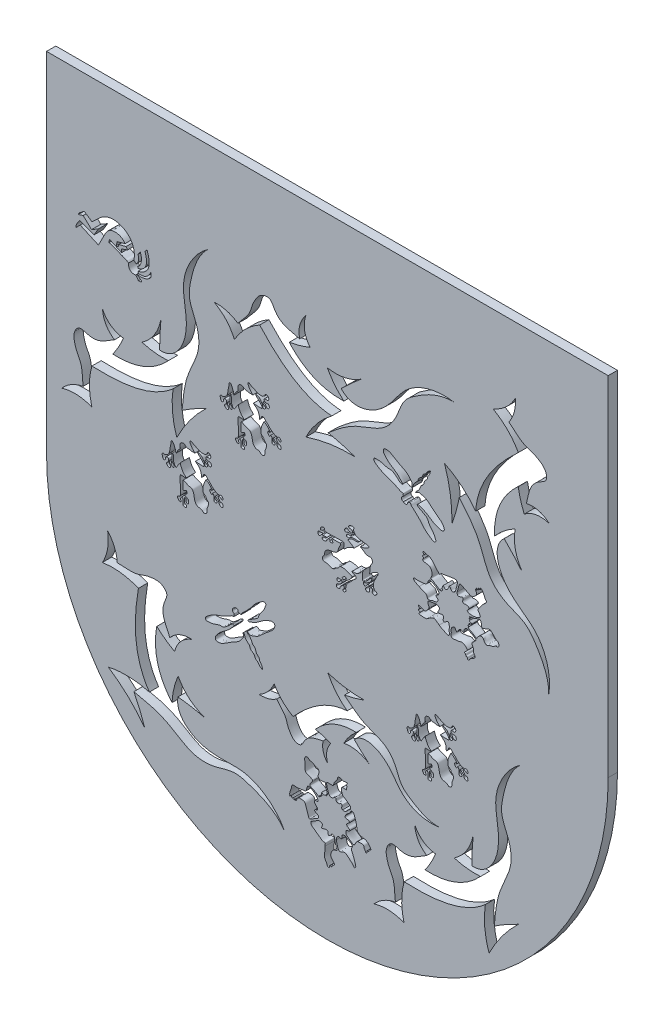
from build123d import *

# Parameters (mm, degrees)
BOSS_EXTRUDE1_DEPTH = 12.7


with BuildPart() as part:
    # Model → Boss-Extrude1 (new body)
    with BuildSketch(Plane.XY):
        with BuildLine():
            ThreePointArc((268.361929772, 473.410515189), (652.536932347, 89.235512614), (1036.711934921, 473.410515189))
            Line((1036.711934921, 473.410515189), (1036.711934921, 949.660508036))
            Line((1036.711934921, 949.660508036), (268.361929772, 949.660508036))
            Line((268.361929772, 949.660508036), (268.361929772, 473.410515189))
        make_face()
        with BuildLine():
            add(Edge.make_bspline(
                [(441.464942066, 636.450600242), (438.702726393, 617.646962667), (440.430275434, 599.291754147), (446.647589145, 581.384974732)],
                knots=[0.49905876, 0.49905876, 0.49905876, 0.49905876, 0.500898346, 0.500898346, 0.500898346, 0.500898346], degree=3))
            add(Edge.make_bspline(
                [(330.435408226, 607.939655137), (368.847035839, 606.37879968), (411.144296516, 609.64534116), (441.464942066, 636.450600242)],
                knots=[0, 0, 0, 0, 1, 1, 1, 1], degree=3))
            add(Edge.make_bspline(
                [(330.349747059, 559.154292642), (329.603195224, 562.249688217), (328.125449526, 568.376801268), (327.076147349, 577.724440634), (326.951280811, 587.445568067), (327.900144367, 597.597000398), (329.586417818, 604.476211044), (330.435408226, 607.939655137)],
                knots=[0, 0, 0, 0, 0.193344003, 0.382710557, 0.570056503, 0.783538127, 1, 1, 1, 1], degree=3))
            add(Edge.make_bspline(
                [(289.230057618, 561.140748431), (303.163485553, 565.241047866), (316.870048935, 564.57889652), (330.349747059, 559.154292642)],
                knots=[0.499056326, 0.499056326, 0.499056326, 0.499056326, 0.500947328, 0.500947328, 0.500947328, 0.500947328], degree=3))
            add(Edge.make_bspline(
                [(318.52568018, 577.868148125), (306.908985813, 575.609170132), (297.143778292, 570.033370234), (289.230057618, 561.140748431)],
                knots=[0.49918026, 0.49918026, 0.49918026, 0.49918026, 0.500868142, 0.500868142, 0.500868142, 0.500868142], degree=3))
            add(Edge.make_bspline(
                [(361.349086345, 654.467761969), (354.385777709, 650.298815571), (343.093680303, 641.479400164), (325.803353291, 641.315192953), (312.935882393, 647.121408679), (304.62009183, 635.402833766), (306.492713027, 624.456023576), (309.662128397, 614.059826733), (318.347608855, 600.643094416), (317.073532281, 586.650014943), (318.52568018, 577.868148125)],
                knots=[0, 0, 0, 0, 0.206068593, 0.324715025, 0.421258636, 0.504248347, 0.613690259, 0.686644446, 0.771393533, 1, 1, 1, 1], degree=3))
            add(Edge.make_bspline(
                [(344.863090632, 682.817785143), (345.147074847, 680.522746569), (345.697916327, 676.071082085), (347.818182035, 669.802890883), (350.630159406, 664.674578837), (353.897449104, 660.572620218), (357.346436492, 657.241572895), (359.99878489, 655.403507776), (361.349086345, 654.467761969)],
                knots=[0, 0, 0, 0, 0.203388266, 0.394510284, 0.579193912, 0.715969942, 0.855401983, 1, 1, 1, 1], degree=3))
            add(Edge.make_bspline(
                [(373.423490641, 662.36384034), (371.418760994, 662.704380851), (367.508733348, 663.368571564), (362.005930986, 665.410988106), (356.887026228, 668.287409821), (352.234371797, 672.164867614), (348.065216143, 677.055334017), (345.951225345, 680.859609838), (344.863090632, 682.817785143)],
                knots=[0, 0, 0, 0, 0.16610708, 0.323975493, 0.477559409, 0.644561888, 0.817045302, 1, 1, 1, 1], degree=3))
            add(Edge.make_bspline(
                [(359.190706131, 636.450601815), (360.583957149, 638.480769411), (363.365853193, 642.53439301), (367.090056359, 648.924666274), (370.501077785, 655.513589559), (372.448255833, 660.077851559), (373.423490641, 662.36384034)],
                knots=[0, 0, 0, 0, 0.24925163, 0.497679251, 0.748415057, 1, 1, 1, 1], degree=3))
            add(Edge.make_bspline(
                [(434.878646501, 666.382097047), (414.889423996, 644.775893949), (389.660109004, 634.798728347), (359.190706131, 636.450601815)],
                knots=[0.498607315, 0.498607315, 0.498607315, 0.498607315, 0.501700265, 0.501700265, 0.501700265, 0.501700265], degree=3))
            add(Edge.make_bspline(
                [(398.79158527, 670.312373666), (410.621456099, 666.811636056), (422.65047651, 665.501543849), (434.878646501, 666.382097047)],
                knots=[0.499294823, 0.499294823, 0.499294823, 0.499294823, 0.500579252, 0.500579252, 0.500579252, 0.500579252], degree=3))
            add(Edge.make_bspline(
                [(424.874309418, 709.972394704), (424.116100344, 706.916539643), (422.629897324, 700.926607353), (418.951348101, 692.538702842), (414.586875804, 685.446676178), (409.71456506, 679.543392118), (404.605890382, 674.572035227), (400.746493524, 671.7445733), (398.79158527, 670.312373666)],
                knots=[0, 0, 0, 0, 0.193794395, 0.379865955, 0.561953143, 0.705376895, 0.850763937, 1, 1, 1, 1], degree=3))
            add(Edge.make_bspline(
                [(423.0878291, 673.170749487), (423.048066832, 685.467661165), (423.643562661, 697.734875227), (424.874309418, 709.972394704)],
                knots=[0.499666629, 0.499666629, 0.499666629, 0.499666629, 0.500357255, 0.500357255, 0.500357255, 0.500357255], degree=3))
            add(Edge.make_bspline(
                [(489.404427764, 825.617219484), (470.805255186, 812.597386276), (449.49374678, 777.699080282), (460.795617329, 732.283358799), (458.650133195, 694.282490163), (439.585491805, 671.970197783), (423.0878291, 673.170749487)],
                knots=[0, 0, 0, 0, 0.384130061, 0.579872371, 0.757797613, 1, 1, 1, 1], degree=3))
            add(Edge.make_bspline(
                [(453.773728934, 617.015673608), (455.066701232, 632.258005967), (457.599910354, 662.41224591), (480.13563683, 697.381476406), (474.395353367, 730.561008554), (461.385939069, 753.591817303), (467.493407695, 788.57483368), (475.672845051, 812.939913808), (489.404427764, 825.617219484)],
                knots=[0, 0, 0, 0, 0.209593873, 0.407161454, 0.535058829, 0.647810963, 0.757163928, 1, 1, 1, 1], degree=3))
            add(Edge.make_bspline(
                [(486.813104213, 635.802769354), (475.32296437, 630.36238622), (464.309839274, 624.100020969), (453.773728934, 617.015673608)],
                knots=[0.499528389, 0.499528389, 0.499528389, 0.499528389, 0.500372649, 0.500372649, 0.500372649, 0.500372649], degree=3))
            add(Edge.make_bspline(
                [(446.647589145, 581.384974732), (456.813519699, 601.884708973), (470.202024722, 620.023973847), (486.813104213, 635.802769354)],
                knots=[0.499152364, 0.499152364, 0.499152364, 0.499152364, 0.500883245, 0.500883245, 0.500883245, 0.500883245], degree=3))
        make_face(mode=Mode.SUBTRACT)
        with BuildLine():
            add(Edge.make_bspline(
                [(474.249473755, 582.540133637), (475.177225779, 582.054062711), (476.622608319, 581.088049932), (479.083938912, 580.381972636), (481.190751857, 580.185159363), (483.11644715, 580.235372528), (484.850965828, 580.196105891), (485.919412546, 581.301710881), (487.430844543, 581.590172824), (487.595494394, 583.062827652), (488.287492324, 584.309805436), (490.351761313, 585.359353683), (491.988165683, 583.771647223), (492.983217039, 582.407172768), (493.25079743, 581.224622747), (492.797261997, 580.044728468), (492.309889517, 579.011938979), (491.304926444, 578.331669759), (490.262268774, 578.541370741), (489.438254079, 578.98045178), (488.684722611, 578.684587535), (487.951406634, 578.673340849), (487.076912443, 578.670666685), (486.420024424, 577.912359779), (486.662490113, 577.09221542), (486.66713733, 576.232367087), (487.566639883, 575.761849628), (488.072887236, 574.740379571), (489.189007671, 574.903521241), (490.199791738, 574.846940327), (491.377189663, 575.008098071), (492.878717424, 574.786039084), (493.542698605, 573.533254662), (493.788350569, 572.368350775), (493.987355507, 571.119688803), (493.315641891, 570.060476492), (492.547414164, 569.251272088), (491.316230885, 569.200289914), (490.199759124, 569.898298805), (489.289392784, 570.988643992), (488.264232262, 571.781621755), (488.351807639, 573.156257562), (486.980852059, 573.353490956), (486.13833737, 574.224915964), (485.06054116, 573.808979218), (484.920546214, 572.930335374), (485.258493051, 572.219387809), (485.441540803, 571.430359142), (486.218473364, 571.083298256), (486.898960212, 570.51202079), (487.819949378, 570.087520577), (488.46736896, 569.347507017), (489.355359699, 568.389351751), (488.15997377, 567.617494521), (487.619156213, 566.618794515), (486.494129565, 566.498314926), (485.397991889, 566.398020972), (484.591765947, 567.371196668), (484.553094483, 568.522153224), (484.538378212, 569.578604722), (484.613839648, 570.593845814), (483.753070684, 571.50320412), (482.74517051, 572.567296301), (481.903026945, 574.277609265), (480.913670198, 575.738615133), (479.583910835, 576.565927995), (478.191039813, 577.363851594), (476.96261317, 577.797436896), (474.863348722, 578.564468689), (475.626059139, 576.086211296), (477.281633235, 574.937586741), (479.249835662, 573.175946383), (481.234008454, 571.37797108), (482.757050198, 569.227616449), (483.981673373, 567.23731106), (483.795304298, 564.937071717), (481.081319318, 565.176770346), (478.648904739, 565.396820965), (475.275781568, 565.405208517), (473.576338736, 565.492365228), (471.505174655, 565.888532429), (473.658267045, 564.461829658), (475.358353454, 563.225266126), (478.700110785, 559.743522318), (480.195996309, 555.471622055), (480.052461584, 552.934890286), (480.097887234, 550.167909577), (481.235487253, 551.772060764), (482.32437935, 552.459502861), (482.725584354, 554.198617239), (483.133883735, 556.081347734), (485.115380968, 556.802977662), (486.878927978, 555.961233414), (487.947949462, 554.34466454), (489.519449604, 552.443768809), (491.670650855, 550.937217709), (493.543873598, 548.800305917), (495.150801355, 546.91806329), (497.039726561, 545.580888264), (498.470973102, 544.352444236), (499.856659019, 543.479213299), (501.076872097, 543.147323505), (502.071689558, 542.401243643), (503.164509622, 542.306117608), (504.388617264, 542.446783641), (505.415389109, 541.683865904), (506.181235414, 542.424795393), (506.560213243, 543.021281986), (507.330413637, 542.929492332), (508.130576561, 542.606687195), (508.765268166, 541.727781122), (509.666526184, 541.12114349), (509.934466934, 540.196931646), (509.64236167, 539.477939939), (509.710852186, 538.633853916), (508.734795094, 538.413642198), (507.762134215, 538.233308288), (507.167937813, 539.172351983), (506.802471736, 539.960401221), (505.958213146, 540.220127085), (505.112940252, 540.361271009), (504.182980393, 540.107031243), (503.44144833, 540.257808873), (502.662176991, 539.97715043), (502.991319638, 539.258477429), (503.178248351, 538.612420718), (503.709940818, 538.053203348), (503.927230601, 537.208591049), (504.911021987, 536.726120972), (505.295230163, 535.645692137), (506.038367284, 534.465939694), (507.507878599, 534.840770236), (508.921124577, 534.273247004), (509.647635144, 532.869042749), (509.375138131, 531.618288097), (509.831848892, 530.412545871), (509.013154972, 529.254886744), (507.845875024, 529.474176553), (506.745032524, 529.390794931), (505.666475368, 530.104302891), (504.453373016, 531.186658071), (504.216058212, 532.98392546), (503.691629444, 534.749603246), (502.343510831, 535.840368916), (500.788780929, 536.48438281), (499.992518871, 538.350884031), (498.357934595, 537.509691243), (499.091076313, 536.193332378), (499.039869504, 534.542537502), (500.190120985, 534.797778155), (500.844770328, 533.827403932), (501.515296917, 532.703695357), (501.512031285, 531.164060636), (500.293021936, 530.088521204), (498.856590771, 530.382625829), (497.327583502, 531.05939988), (497.527538716, 532.907138221), (497.518778172, 534.447341623), (497.349792001, 536.051493148), (497.269787886, 537.612320254), (496.972163395, 538.900137317), (495.542917911, 540.089425133), (495.267416997, 538.549391045), (494.435610154, 536.703384233), (492.781314855, 538.869006306), (491.593140102, 540.244625525), (491.444081237, 542.179503204), (493.079542019, 543.710453553), (493.7203278, 541.970995462), (495.288576426, 543.009356402), (493.721733393, 544.671930562), (492.611582114, 546.689135868), (490.310728966, 548.788875217), (488.451313537, 550.260692481), (486.213033432, 551.227513609), (485.077425956, 547.930731305), (483.659333152, 545.111959163), (482.374696961, 541.239933349), (482.262436834, 537.904784789), (482.052689519, 534.624449396), (484.417532633, 532.788400328), (486.411978671, 531.440160261), (486.813145253, 529.092470316), (488.959477668, 527.434051256), (490.65640755, 524.584735299), (489.450984028, 521.651456775), (488.5551021, 519.186926196), (487.414021887, 516.473805274), (488.091793758, 513.606901904), (486.875364871, 510.747611538), (483.89021908, 509.990240135), (481.657382754, 511.763018163), (479.435378971, 513.647966499), (476.11522609, 513.307607049), (473.107505517, 515.155676875), (471.052034362, 518.395389936), (470.39425327, 522.904618972), (469.66610167, 526.894293121), (467.175034982, 532.02842479), (462.19801391, 531.243816621), (455.009473314, 536.704381913), (455.125168124, 534.180876875), (455.115960146, 533.472436346), (455.131992675, 531.518605322), (455.025481025, 528.728209642), (455.31013797, 525.839581938), (454.839913271, 523.959105326), (455.641528187, 523.014358064), (456.49360111, 523.206180138), (457.27799482, 523.687479801), (458.138318591, 524.408118662), (459.541731817, 525.074196526), (460.331418605, 523.94282835), (460.453655889, 522.89541352), (460.644395489, 521.847652748), (460.144291123, 520.631466472), (459.014072817, 520.532207867), (457.956322895, 520.775747998), (457.339677883, 519.604686126), (457.753404581, 518.423990332), (458.56843144, 517.432957134), (459.72200871, 516.89557404), (460.756013262, 516.477663937), (461.895398639, 516.0386468), (462.594895983, 514.916616406), (462.889593153, 513.453535468), (462.981832057, 511.962209049), (462.474891392, 510.65655418), (461.32433451, 509.741241637), (459.972264785, 510.502133677), (459.075096592, 511.636324506), (458.749021188, 512.992493082), (458.991213483, 514.273978027), (458.768600273, 515.500348121), (457.517512535, 515.820465745), (456.990342312, 514.75568937), (457.239001643, 513.55564664), (457.115920018, 512.180420984), (457.276488923, 510.837824906), (457.209732241, 509.428059266), (458.309351769, 508.197141575), (459.918854865, 507.633650706), (460.404408791, 505.631776579), (458.777169926, 504.107026638), (456.965422552, 504.437035111), (454.858218866, 504.83053438), (455.206770583, 506.493849849), (455.086287975, 507.877112657), (455.141709204, 509.423732287), (455.068437549, 510.94734701), (455.374408903, 512.620394864), (454.403306787, 513.586917763), (453.410821317, 514.667196905), (452.732799139, 513.495453466), (452.02276225, 512.764643776), (451.690231142, 511.613504573), (451.563886769, 510.283507404), (452.49118486, 509.436064847), (452.758337419, 507.728317396), (451.051076425, 507.934710357), (449.539718112, 507.666368181), (448.574117665, 509.402823886), (447.444713825, 510.683478171), (447.458592406, 512.503867533), (448.586349501, 513.239084358), (449.738482366, 512.839468316), (450.723629282, 514.267285115), (451.882696283, 516.815287616), (451.272103762, 521.642375398), (451.513434862, 527.776262936), (451.46613142, 533.818018553), (450.917929693, 537.808879113), (451.722938261, 540.346226601), (454.002983538, 539.617875429), (456.401641203, 539.978034499), (458.063438797, 539.335879624), (459.666128127, 539.897704643), (458.473570801, 541.106125936), (456.994664581, 542.466613003), (454.039120029, 545.710995025), (452.657523919, 549.667421824), (451.475287609, 551.94451697), (451.527495503, 554.269440932), (450.413718897, 552.441342878), (449.659863583, 551.390538318), (448.244368078, 549.884671182), (447.565332488, 548.003247049), (446.521441141, 546.884750877), (445.843138201, 545.112975583), (444.745400911, 546.293285383), (443.767646517, 547.267854549), (442.879777098, 549.090349815), (441.734732482, 551.001732896), (441.862944797, 553.227326332), (441.776061521, 555.362400477), (441.998695774, 557.497889664), (441.655649438, 558.959943421), (440.606731743, 560.577637111), (440.113011566, 558.77274939), (440.23705485, 557.595001113), (439.790475407, 556.151902194), (439.975780873, 554.428765524), (440.108296012, 552.763229415), (439.959664154, 551.186298704), (440.331239943, 549.991587306), (440.89276963, 548.803713468), (441.685659673, 547.693011668), (443.047300884, 546.728040696), (442.738550181, 545.282013739), (442.715226263, 544.137221556), (442.068522231, 543.079920297), (440.719736133, 543.268073696), (439.755008599, 544.246745444), (438.673445202, 545.55193313), (438.788426793, 547.168532368), (439.364534007, 548.367633949), (438.918300214, 549.481853746), (437.912107014, 550.085079223), (436.790282445, 549.672831491), (436.62830718, 548.666977199), (436.688712823, 547.60040216), (436.571480128, 546.510795586), (436.918422381, 545.264488163), (437.237183957, 544.065238557), (437.985879636, 542.942017109), (437.906782156, 541.497680125), (436.549391359, 540.434493726), (434.892039118, 541.088781164), (433.561670267, 541.934160037), (432.601738187, 543.197555816), (432.490370613, 544.836889088), (433.660694499, 545.620173006), (434.784837245, 545.890035314), (434.922693413, 546.872805785), (434.851965814, 547.904538317), (435.002102013, 549.272274307), (435.423484537, 550.803923183), (434.220881689, 551.722559127), (433.114567119, 551.32812264), (431.810928079, 551.32481229), (430.970963789, 550.122258434), (430.997580202, 548.538048212), (430.818364825, 546.460481167), (428.575023205, 546.190133838), (427.043133135, 548.000678551), (426.746509275, 550.185277302), (426.302000769, 552.420933624), (427.569827571, 553.602113686), (428.876407672, 553.440421747), (429.678160817, 552.497221337), (430.819355315, 553.160181676), (432.031789031, 553.7292878), (433.598011091, 554.527496568), (434.741600276, 555.80410248), (435.86890679, 556.838777033), (436.218305725, 558.247133331), (436.513958113, 559.700903129), (437.078882608, 561.38251828), (437.470450567, 563.423093372), (437.487956025, 565.753079227), (438.39842288, 568.075906822), (438.291565702, 570.477143037), (438.868797159, 572.233117495), (439.122463133, 574.382185178), (440.913559898, 573.738537286), (441.896445095, 572.462128472), (442.956076663, 570.917079983), (443.268847805, 569.105438314), (444.053091853, 567.598609081), (444.718156328, 565.922200831), (444.380562194, 564.15854941), (445.480510275, 563.303575609), (444.927087314, 562.094128705), (445.955488051, 562.306499416), (445.867532786, 563.561950584), (446.748061518, 564.671485825), (447.71142208, 565.965163231), (448.700061287, 567.760206128), (450.428162502, 569.156264403), (451.257209552, 571.315116154), (450.841880814, 573.051450697), (451.040814362, 574.63722657), (450.974629564, 576.206603324), (451.900471928, 577.89075217), (453.539656859, 578.512034455), (455.350276901, 579.386093597), (456.918055268, 578.364094307), (458.323695279, 577.767568692), (459.168361176, 576.816052185), (460.717618926, 576.290676841), (462.416994916, 575.719976704), (464.446401849, 575.930845777), (466.340065518, 574.945198098), (468.755099577, 575.474234597), (470.093692918, 574.98667354), (471.569910735, 575.122581367), (470.736965144, 575.829175048), (470.09096725, 576.410894695), (469.083375352, 577.659141312), (467.781133062, 578.870103276), (466.584279079, 580.561969508), (465.447328819, 582.684084249), (464.424533293, 584.522258261), (464.673900623, 586.859766284), (466.397617424, 586.71435961), (467.829633133, 585.952584196), (469.510295797, 584.570596469), (471.840114174, 583.621237579), (473.457473601, 582.955080993), (474.249473755, 582.540133637)],
                knots=[0, 0, 0, 0, 0.004638884, 0.007618376, 0.011253206, 0.013916785, 0.016312043, 0.018449775, 0.020492256, 0.022207198, 0.024295682, 0.026807129, 0.031134139, 0.032506092, 0.034446327, 0.036131996, 0.038008211, 0.039460274, 0.0410886, 0.042473683, 0.043350718, 0.044496209, 0.04574742, 0.047099441, 0.048150162, 0.049419326, 0.050564817, 0.052313721, 0.053838736, 0.05498027, 0.056885204, 0.059146367, 0.061072559, 0.062641447, 0.064546381, 0.066376201, 0.06799617, 0.069236485, 0.071491637, 0.073509603, 0.075678852, 0.076742413, 0.078830897, 0.080532596, 0.081769258, 0.083038421, 0.083940883, 0.085302907, 0.086331872, 0.087493055, 0.089287923, 0.090633234, 0.092085298, 0.093912644, 0.095461213, 0.097030101, 0.098555116, 0.100103686, 0.101933506, 0.103550679, 0.104885862, 0.106179741, 0.108810847, 0.111453963, 0.114574388, 0.116421437, 0.118380239, 0.121453913, 0.123377755, 0.125113675, 0.129517826, 0.133324688, 0.136512334, 0.141441295, 0.144790709, 0.147141566, 0.149460919, 0.154748989, 0.159257001, 0.16330275, 0.164266467, 0.165899474, 0.16994636, 0.177217208, 0.185396198, 0.188101128, 0.190853194, 0.1922877, 0.194439458, 0.196952688, 0.199683905, 0.202572771, 0.204770526, 0.207887804, 0.211005081, 0.215680998, 0.219388731, 0.223574413, 0.226584407, 0.229594401, 0.231943032, 0.233763843, 0.235126833, 0.237350446, 0.238364794, 0.240620311, 0.241702811, 0.242659148, 0.243504438, 0.244791946, 0.246465536, 0.248139126, 0.249533215, 0.25023026, 0.251624348, 0.252534754, 0.254225335, 0.255545721, 0.257000014, 0.25791042, 0.25927341, 0.260804296, 0.261987703, 0.262743754, 0.263772094, 0.2646825, 0.265901595, 0.267035671, 0.268356057, 0.270327597, 0.272124709, 0.273646232, 0.276377449, 0.278267577, 0.280127216, 0.281826229, 0.283753788, 0.284937194, 0.286804502, 0.288545062, 0.290457736, 0.293826195, 0.296180902, 0.298455346, 0.30112839, 0.303880456, 0.305014532, 0.307556033, 0.309534807, 0.31021104, 0.312008152, 0.313898279, 0.316271123, 0.318068235, 0.320272483, 0.322476731, 0.324512461, 0.327555506, 0.329591236, 0.331626965, 0.334358182, 0.335953073, 0.337240581, 0.339821141, 0.342700097, 0.345747835, 0.348626791, 0.350690408, 0.352487521, 0.353850511, 0.356425527, 0.359943399, 0.365203252, 0.369330487, 0.371258046, 0.374305784, 0.381276228, 0.387267663, 0.391507619, 0.396436467, 0.4005009, 0.403969682, 0.406700899, 0.410295124, 0.415739215, 0.41975768, 0.423556789, 0.427621221, 0.432354848, 0.436135103, 0.440153568, 0.443865154, 0.44827365, 0.452530424, 0.457752104, 0.463003801, 0.469073434, 0.477602076, 0.481460899, 0.492385768, 0.50137292, 0.502085944, 0.502846279, 0.504566162, 0.510693245, 0.515207939, 0.517465285, 0.518841106, 0.51970774, 0.52105462, 0.522903994, 0.524912123, 0.526742658, 0.527838872, 0.529669407, 0.531496783, 0.532698588, 0.534421827, 0.535675396, 0.537657464, 0.539639531, 0.541226642, 0.543202871, 0.544645037, 0.546494411, 0.54871043, 0.551290254, 0.552927534, 0.554865386, 0.556841616, 0.558906483, 0.561331629, 0.562626012, 0.564802573, 0.566004378, 0.567167089, 0.569209451, 0.571466797, 0.573190036, 0.575243681, 0.5774597, 0.579934368, 0.582464445, 0.584973888, 0.588306161, 0.590793595, 0.592405985, 0.594734994, 0.597243157, 0.599124279, 0.601632442, 0.604062866, 0.605281248, 0.606801425, 0.608467658, 0.610167267, 0.611958811, 0.613925435, 0.615719218, 0.617530806, 0.619866694, 0.622217991, 0.625229172, 0.627662641, 0.629029979, 0.630552792, 0.632326331, 0.635655183, 0.643343528, 0.652734539, 0.663271825, 0.669813164, 0.670807204, 0.674098736, 0.677540493, 0.681976099, 0.682592576, 0.683143971, 0.687798622, 0.693325318, 0.701702961, 0.705165561, 0.706724408, 0.708421919, 0.711074188, 0.71392719, 0.717064829, 0.719566073, 0.721493073, 0.722926844, 0.725000855, 0.728213344, 0.731594337, 0.734681389, 0.737764589, 0.741234046, 0.743722191, 0.745252185, 0.747185342, 0.748882853, 0.75122715, 0.753463799, 0.756550851, 0.758632011, 0.760389706, 0.76201022, 0.764430581, 0.766504592, 0.768662833, 0.770221679, 0.771763279, 0.773383794, 0.775358005, 0.777859249, 0.78055815, 0.781998123, 0.783558874, 0.785386175, 0.78663144, 0.788167249, 0.789400529, 0.791481689, 0.792902974, 0.79509671, 0.796959432, 0.798738962, 0.800990174, 0.803364688, 0.80597291, 0.808025324, 0.810260644, 0.812234855, 0.81382203, 0.814775457, 0.816239977, 0.818487226, 0.821030867, 0.822295073, 0.824305073, 0.825877203, 0.827851415, 0.829868792, 0.833184128, 0.83536428, 0.838091649, 0.84265502, 0.84535282, 0.847426831, 0.849214689, 0.850669031, 0.852131522, 0.854199796, 0.856962875, 0.859668596, 0.861817682, 0.863537653, 0.865931279, 0.868439449, 0.87136536, 0.875115158, 0.878639193, 0.882304312, 0.885245658, 0.887684262, 0.889361582, 0.891888935, 0.895127279, 0.897389948, 0.899930406, 0.90260966, 0.905346876, 0.906910566, 0.908231472, 0.908704105, 0.910551021, 0.912603841, 0.914997466, 0.917691328, 0.921601904, 0.924649106, 0.927309328, 0.929309277, 0.931695071, 0.934208319, 0.937146522, 0.939345265, 0.942593854, 0.944552656, 0.946172625, 0.948046426, 0.951668786, 0.954048884, 0.956819048, 0.960814417, 0.963777157, 0.964561601, 0.965304574, 0.967121988, 0.969278686, 0.972037393, 0.975100746, 0.978380932, 0.982623463, 0.984792712, 0.986602643, 0.988901511, 0.992252658, 0.996039893, 1, 1, 1, 1], degree=3))
        make_face(mode=Mode.SUBTRACT)
        with BuildLine():
            add(Edge.make_bspline(
                [(534.469990541, 643.184620542), (534.459029724, 643.039130022), (534.475325288, 642.683695431), (534.46611731, 641.975254903), (534.482149839, 640.021423879), (534.375638189, 637.231028199), (534.660295134, 634.342400495), (534.190070435, 632.461923883), (534.99168535, 631.51717662), (535.843758273, 631.708998694), (536.628151984, 632.190298357), (537.488475755, 632.910937219), (538.891888981, 633.577015083), (539.681575768, 632.445646906), (539.803813052, 631.398232076), (539.994552652, 630.350471305), (539.494448287, 629.134285029), (538.364229981, 629.035026424), (537.306480058, 629.278566554), (536.689835046, 628.107504683), (537.103561745, 626.926808888), (537.918588604, 625.93577569), (539.072165874, 625.398392596), (540.106170426, 624.980482493), (541.245555803, 624.541465356), (541.945053147, 623.419434962), (542.239750317, 621.956354025), (542.331989221, 620.465027605), (541.825048556, 619.159372736), (540.674491673, 618.244060193), (539.322421949, 619.004952233), (538.425253756, 620.139143062), (538.099178352, 621.495311638), (538.341370647, 622.776796584), (538.118757436, 624.003166677), (536.867669699, 624.323284302), (536.340499476, 623.258507926), (536.589158807, 622.058465196), (536.466077182, 620.68323954), (536.626646087, 619.340643462), (536.559889404, 617.930877823), (537.659508933, 616.699960131), (539.269012029, 616.136469262), (539.754565955, 614.134595135), (538.12732709, 612.609845194), (536.315579715, 612.939853667), (534.20837603, 613.333352936), (534.556927747, 614.996668406), (534.436445138, 616.379931214), (534.491866368, 617.926550843), (534.418594713, 619.450165567), (534.724566066, 621.123213421), (533.75346395, 622.08973632), (532.76097848, 623.170015461), (532.082956302, 621.998272022), (531.372919414, 621.267462332), (531.040388306, 620.116323129), (530.914043933, 618.78632596), (531.841342024, 617.938883403), (532.108494583, 616.231135952), (530.401233589, 616.437528913), (528.889875276, 616.169186737), (527.924274829, 617.905642442), (526.794870989, 619.186296727), (526.80874957, 621.00668609), (527.936506665, 621.741902914), (529.088639529, 621.342286872), (530.073786446, 622.770103671), (531.232853447, 625.318106173), (530.622260925, 630.145193954), (530.863592026, 636.279081492), (530.816288584, 642.320837109), (530.268086857, 646.311697669), (531.073095424, 648.849045158), (533.353140702, 648.120693986), (535.751798367, 648.480853055), (537.413595961, 647.83869818), (539.01628529, 648.400523199), (537.823727965, 649.608944492), (536.344821744, 650.969431559), (533.389277193, 654.213813582), (532.007681083, 658.17024038), (530.825444773, 660.447335526), (530.877652667, 662.772259488), (529.763876061, 660.944161434), (529.010020747, 659.893356875), (527.594525241, 658.387489738), (526.915489652, 656.506065606), (525.871598305, 655.387569433), (525.193295365, 653.615794139), (524.095558075, 654.796103939), (523.117803681, 655.770673106), (522.229934262, 657.593168372), (521.084889646, 659.504551453), (521.213101961, 661.730144888), (521.126218685, 663.865219034), (521.348852938, 666.000708221), (521.005806602, 667.462761977), (519.956888907, 669.080455667), (519.463168729, 667.275567946), (519.587212014, 666.097819669), (519.140632571, 664.654720751), (519.325938036, 662.93158408), (519.458453176, 661.266047971), (519.309821318, 659.68911726), (519.681397106, 658.494405863), (520.242926794, 657.306532024), (521.035816836, 656.195830225), (522.397458047, 655.230859252), (522.088707345, 653.784832295), (522.065383427, 652.640040112), (521.418679395, 651.582738854), (520.069893297, 651.770892252), (519.105165763, 652.749564001), (518.023602366, 654.054751686), (518.138583956, 655.671350925), (518.71469117, 656.870452506), (518.268457377, 657.984672302), (517.262264178, 658.587897779), (516.140439608, 658.175650047), (515.978464344, 657.169795755), (516.038869987, 656.103220716), (515.921637292, 655.013614143), (516.268579544, 653.767306719), (516.587341121, 652.568057113), (517.3360368, 651.444835665), (517.256939319, 650.000498682), (515.899548523, 648.937312283), (514.242196282, 649.59159972), (512.911827431, 650.436978593), (511.951895351, 651.700374372), (511.840527777, 653.339707644), (513.010851663, 654.122991563), (514.134994409, 654.39285387), (514.272850577, 655.375624341), (514.202122978, 656.407356873), (514.352259177, 657.775092863), (514.773641701, 659.30674174), (513.571038853, 660.225377683), (512.464724283, 659.830941196), (511.161085243, 659.827630846), (510.321120953, 658.625076991), (510.347737366, 657.040866769), (510.168521989, 654.963299724), (507.925180369, 654.692952394), (506.393290299, 656.503497108), (506.096666439, 658.688095858), (505.652157933, 660.92375218), (506.919984735, 662.104932242), (508.226564836, 661.943240304), (509.028317981, 661.000039894), (510.169512478, 661.663000232), (511.381946195, 662.232106357), (512.948168255, 663.030315124), (514.09175744, 664.306921036), (515.219063954, 665.341595589), (515.568462888, 666.749951888), (515.864115276, 668.203721685), (516.429039771, 669.885336836), (516.82060773, 671.925911928), (516.838113189, 674.255897784), (517.748580044, 676.578725378), (517.641722866, 678.979961593), (518.218954323, 680.735936051), (518.472620297, 682.885003734), (520.263717062, 682.241355842), (521.246602259, 680.964947029), (522.306233826, 679.419898539), (522.619004969, 677.60825687), (523.403249017, 676.101427637), (524.068313492, 674.425019387), (523.730719358, 672.661367966), (524.830667439, 671.806394165), (524.277244478, 670.596947262), (525.305645215, 670.809317972), (525.21768995, 672.064769141), (526.098218681, 673.174304381), (527.061579244, 674.467981788), (528.050218451, 676.263024685), (529.778319666, 677.65908296), (530.607366716, 679.81793471), (530.192037978, 681.554269254), (530.390971525, 683.140045126), (530.324786728, 684.70942188), (531.250629092, 686.393570726), (532.889814023, 687.014853011), (534.700434065, 687.888912153), (536.268212431, 686.866912864), (537.673852443, 686.270387248), (538.51851834, 685.318870741), (540.06777609, 684.793495397), (541.767152079, 684.222795261), (543.796559013, 684.433664334), (545.690222682, 683.448016654), (548.105256741, 683.977053153), (549.443850082, 683.489492097), (550.920067899, 683.625399924), (550.087122308, 684.331993604), (549.441124414, 684.913713252), (548.433532516, 686.161959869), (547.131290226, 687.372921833), (545.934436243, 689.064788064), (544.797485983, 691.186902805), (543.774690457, 693.025076818), (544.024057787, 695.36258484), (545.747774588, 695.217178166), (547.179790297, 694.455402753), (548.86045296, 693.073415026), (551.190271338, 692.124056136), (553.77605884, 691.05902424), (555.972765483, 689.590868488), (558.434096075, 688.884791192), (560.54090902, 688.68797792), (562.466604314, 688.738191084), (564.201122992, 688.698924447), (565.269569709, 689.804529438), (566.781001707, 690.09299138), (566.945651558, 691.565646209), (567.637649488, 692.812623993), (569.701918476, 693.862172239), (571.338322847, 692.27446578), (572.333374203, 690.909991325), (572.600954593, 689.727441303), (572.147419161, 688.547547025), (571.660046681, 687.514757535), (570.655083608, 686.834488315), (569.612425938, 687.044189297), (568.788411243, 687.483270336), (568.034879775, 687.187406091), (567.301563798, 687.176159405), (566.427069607, 687.173485241), (565.770181587, 686.415178335), (566.012647277, 685.595033977), (566.017294494, 684.735185643), (566.916797047, 684.264668184), (567.4230444, 683.243198127), (568.539164835, 683.406339797), (569.549948901, 683.349758883), (570.727346826, 683.510916628), (572.228874587, 683.288857641), (572.892855769, 682.036073218), (573.138507732, 680.871169331), (573.33751267, 679.622507359), (572.665799055, 678.563295049), (571.897571328, 677.754090644), (570.666388049, 677.70310847), (569.549916288, 678.401117361), (568.639549947, 679.491462549), (567.614389425, 680.284440311), (567.701964803, 681.659076118), (566.331009223, 681.856309512), (565.488494534, 682.727734521), (564.410698323, 682.311797774), (564.270703378, 681.43315393), (564.608650215, 680.722206366), (564.791697966, 679.933177699), (565.568630527, 679.586116812), (566.249117376, 679.014839346), (567.170106541, 678.590339133), (567.817526124, 677.850325574), (568.705516863, 676.892170307), (567.510130934, 676.120313077), (566.969313377, 675.121613071), (565.844286729, 675.001133482), (564.748149053, 674.900839528), (563.941923111, 675.874015224), (563.903251646, 677.024971781), (563.888535376, 678.081423279), (563.963996812, 679.09666437), (563.103227847, 680.006022676), (562.095327673, 681.070114857), (561.253184108, 682.780427822), (560.263827361, 684.241433689), (558.934067998, 685.068746551), (557.541196977, 685.866670151), (556.312770334, 686.300255452), (554.213505886, 687.067287245), (554.976216303, 684.589029853), (556.631790399, 683.440405298), (558.599992825, 681.678764939), (560.584165618, 679.880789637), (562.107207362, 677.730435005), (563.331830537, 675.740129616), (563.145461461, 673.439890273), (560.431476482, 673.679588902), (557.999061903, 673.899639521), (554.625938732, 673.908027073), (552.9264959, 673.995183784), (550.855331819, 674.391350985), (553.008424209, 672.964648214), (554.708510618, 671.728084682), (558.050267949, 668.246340874), (559.546153472, 663.974440612), (559.402618747, 661.437708843), (559.448044398, 658.670728134), (560.585644416, 660.27487932), (561.674536514, 660.962321417), (562.075741518, 662.701435795), (562.484040899, 664.584166291), (564.465538132, 665.305796218), (566.229085141, 664.46405197), (567.298106626, 662.847483097), (568.869606768, 660.946587366), (571.020808019, 659.440036266), (572.894030762, 657.303124474), (574.500958519, 655.420881846), (576.389883725, 654.08370682), (577.821130266, 652.855262793), (579.206816183, 651.982031855), (580.427029261, 651.650142061), (581.421846722, 650.904062199), (582.514666786, 650.808936165), (583.738774427, 650.949602197), (584.765546272, 650.18668446), (585.531392578, 650.927613949), (585.910370407, 651.524100543), (586.680570801, 651.432310888), (587.480733725, 651.109505752), (588.11542533, 650.230599678), (589.016683347, 649.623962047), (589.284624098, 648.699750202), (588.992518834, 647.980758496), (589.06100935, 647.136672473), (588.084952258, 646.916460755), (587.112291379, 646.736126845), (586.518094977, 647.675170539), (586.1526289, 648.463219777), (585.30837031, 648.722945642), (584.463097416, 648.864089566), (583.533137557, 648.6098498), (582.791605494, 648.76062743), (582.012334154, 648.479968986), (582.341476802, 647.761295986), (582.528405514, 647.115239274), (583.060097982, 646.556021905), (583.277387765, 645.711409605), (584.261179151, 645.228939528), (584.645387327, 644.148510693), (585.388524448, 642.968758251), (586.858035762, 643.343588792), (588.271281741, 642.77606556), (588.997792308, 641.371861306), (588.725295295, 640.121106654), (589.182006056, 638.915364427), (588.363312136, 637.7577053), (587.196032188, 637.97699511), (586.095189688, 637.893613487), (585.016632531, 638.607121448), (583.80353018, 639.689476628), (583.566215376, 641.486744016), (583.041786608, 643.252421802), (581.693667994, 644.343187472), (580.138938093, 644.987201366), (579.342676035, 646.853702587), (577.708091759, 646.012509799), (578.441233477, 644.696150934), (578.390026668, 643.045356058), (579.540278149, 643.300596711), (580.194927492, 642.330222489), (580.865454081, 641.206513914), (580.862188449, 639.666879193), (579.6431791, 638.59133976), (578.206747934, 638.885444385), (576.677740666, 639.562218436), (576.87769588, 641.409956777), (576.868935336, 642.950160179), (576.699949165, 644.554311705), (576.619945049, 646.11513881), (576.322320558, 647.402955873), (574.893075074, 648.59224369), (574.61757416, 647.052209601), (573.785767318, 645.206202789), (572.131472018, 647.371824862), (570.943297266, 648.747444081), (570.794238401, 650.68232176), (572.429699183, 652.213272109), (573.070484964, 650.473814018), (574.63873359, 651.512174958), (573.071890557, 653.174749118), (571.961739278, 655.191954425), (569.66088613, 657.291693773), (567.801470701, 658.763511037), (565.563190596, 659.730332165), (564.42758312, 656.433549862), (563.009490316, 653.61477772), (561.724854124, 649.742751905), (561.612593997, 646.407603345), (561.402846683, 643.127267953), (563.767689797, 641.291218884), (565.762135835, 639.942978817), (566.163302417, 637.595288872), (568.309634832, 635.936869812), (570.006564713, 633.087553855), (568.801141192, 630.154275331), (567.905259264, 627.689744752), (566.76417905, 624.976623831), (567.441950921, 622.109720461), (566.225522035, 619.250430095), (563.240376244, 618.493058691), (561.007539918, 620.26583672), (558.785536135, 622.150785055), (555.465383254, 621.810425605), (552.457662681, 623.658495432), (550.402191526, 626.898208492), (549.744410434, 631.407437529), (549.016258834, 635.397111678), (546.525192145, 640.531243346), (541.548171073, 639.746635178), (534.608143808, 645.018424563), (534.469990541, 643.184620542)],
                knots=[0.50137292, 0.50137292, 0.50137292, 0.50137292, 0.502085944, 0.502846279, 0.504566162, 0.510693245, 0.515207939, 0.517465285, 0.518841106, 0.51970774, 0.52105462, 0.522903994, 0.524912123, 0.526742658, 0.527838872, 0.529669407, 0.531496783, 0.532698588, 0.534421827, 0.535675396, 0.537657464, 0.539639531, 0.541226642, 0.543202871, 0.544645037, 0.546494411, 0.54871043, 0.551290254, 0.552927534, 0.554865386, 0.556841616, 0.558906483, 0.561331629, 0.562626012, 0.564802573, 0.566004378, 0.567167089, 0.569209451, 0.571466797, 0.573190036, 0.575243681, 0.5774597, 0.579934368, 0.582464445, 0.584973888, 0.588306161, 0.590793595, 0.592405985, 0.594734994, 0.597243157, 0.599124279, 0.601632442, 0.604062866, 0.605281248, 0.606801425, 0.608467658, 0.610167267, 0.611958811, 0.613925435, 0.615719218, 0.617530806, 0.619866694, 0.622217991, 0.625229172, 0.627662641, 0.629029979, 0.630552792, 0.632326331, 0.635655183, 0.643343528, 0.652734539, 0.663271825, 0.669813164, 0.670807204, 0.674098736, 0.677540493, 0.681976099, 0.682592576, 0.683143971, 0.687798622, 0.693325318, 0.701702961, 0.705165561, 0.706724408, 0.708421919, 0.711074188, 0.71392719, 0.717064829, 0.719566073, 0.721493073, 0.722926844, 0.725000855, 0.728213344, 0.731594337, 0.734681389, 0.737764589, 0.741234046, 0.743722191, 0.745252185, 0.747185342, 0.748882853, 0.75122715, 0.753463799, 0.756550851, 0.758632011, 0.760389706, 0.76201022, 0.764430581, 0.766504592, 0.768662833, 0.770221679, 0.771763279, 0.773383794, 0.775358005, 0.777859249, 0.78055815, 0.781998123, 0.783558874, 0.785386175, 0.78663144, 0.788167249, 0.789400529, 0.791481689, 0.792902974, 0.79509671, 0.796959432, 0.798738962, 0.800990174, 0.803364688, 0.80597291, 0.808025324, 0.810260644, 0.812234855, 0.81382203, 0.814775457, 0.816239977, 0.818487226, 0.821030867, 0.822295073, 0.824305073, 0.825877203, 0.827851415, 0.829868792, 0.833184128, 0.83536428, 0.838091649, 0.84265502, 0.84535282, 0.847426831, 0.849214689, 0.850669031, 0.852131522, 0.854199796, 0.856962875, 0.859668596, 0.861817682, 0.863537653, 0.865931279, 0.868439449, 0.87136536, 0.875115158, 0.878639193, 0.882304312, 0.885245658, 0.887684262, 0.889361582, 0.891888935, 0.895127279, 0.897389948, 0.899930406, 0.90260966, 0.905346876, 0.906910566, 0.908231472, 0.908704105, 0.910551021, 0.912603841, 0.914997466, 0.917691328, 0.921601904, 0.924649106, 0.927309328, 0.929309277, 0.931695071, 0.934208319, 0.937146522, 0.939345265, 0.942593854, 0.944552656, 0.946172625, 0.948046426, 0.951668786, 0.954048884, 0.956819048, 0.960814417, 0.963777157, 0.964561601, 0.965304574, 0.967121988, 0.969278686, 0.972037393, 0.975100746, 0.978380932, 0.982623463, 0.984792712, 0.986602643, 0.988901511, 0.992252658, 0.996039893, 1, 1.004638884, 1.007618376, 1.011253206, 1.013916785, 1.016312043, 1.018449775, 1.020492256, 1.022207198, 1.024295682, 1.026807129, 1.031134139, 1.032506092, 1.034446327, 1.036131996, 1.038008211, 1.039460274, 1.0410886, 1.042473683, 1.043350718, 1.044496209, 1.04574742, 1.047099441, 1.048150162, 1.049419326, 1.050564817, 1.052313721, 1.053838736, 1.05498027, 1.056885204, 1.059146367, 1.061072559, 1.062641447, 1.064546381, 1.066376201, 1.06799617, 1.069236485, 1.071491637, 1.073509603, 1.075678852, 1.076742413, 1.078830897, 1.080532596, 1.081769258, 1.083038421, 1.083940883, 1.085302907, 1.086331872, 1.087493055, 1.089287923, 1.090633234, 1.092085298, 1.093912644, 1.095461213, 1.097030101, 1.098555116, 1.100103686, 1.101933506, 1.103550679, 1.104885862, 1.106179741, 1.108810847, 1.111453963, 1.114574388, 1.116421437, 1.118380239, 1.121453913, 1.123377755, 1.125113675, 1.129517826, 1.133324688, 1.136512334, 1.141441295, 1.144790709, 1.147141566, 1.149460919, 1.154748989, 1.159257001, 1.16330275, 1.164266467, 1.165899474, 1.16994636, 1.177217208, 1.185396198, 1.188101128, 1.190853194, 1.1922877, 1.194439458, 1.196952688, 1.199683905, 1.202572771, 1.204770526, 1.207887804, 1.211005081, 1.215680998, 1.219388731, 1.223574413, 1.226584407, 1.229594401, 1.231943032, 1.233763843, 1.235126833, 1.237350446, 1.238364794, 1.240620311, 1.241702811, 1.242659148, 1.243504438, 1.244791946, 1.246465536, 1.248139126, 1.249533215, 1.25023026, 1.251624348, 1.252534754, 1.254225335, 1.255545721, 1.257000014, 1.25791042, 1.25927341, 1.260804296, 1.261987703, 1.262743754, 1.263772094, 1.2646825, 1.265901595, 1.267035671, 1.268356057, 1.270327597, 1.272124709, 1.273646232, 1.276377449, 1.278267577, 1.280127216, 1.281826229, 1.283753788, 1.284937194, 1.286804502, 1.288545062, 1.290457736, 1.293826195, 1.296180902, 1.298455346, 1.30112839, 1.303880456, 1.305014532, 1.307556033, 1.309534807, 1.31021104, 1.312008152, 1.313898279, 1.316271123, 1.318068235, 1.320272483, 1.322476731, 1.324512461, 1.327555506, 1.329591236, 1.331626965, 1.334358182, 1.335953073, 1.337240581, 1.339821141, 1.342700097, 1.345747835, 1.348626791, 1.350690408, 1.352487521, 1.353850511, 1.356425527, 1.359943399, 1.365203252, 1.369330487, 1.371258046, 1.374305784, 1.381276228, 1.387267663, 1.391507619, 1.396436467, 1.4005009, 1.403969682, 1.406700899, 1.410295124, 1.415739215, 1.41975768, 1.423556789, 1.427621221, 1.432354848, 1.436135103, 1.440153568, 1.443865154, 1.44827365, 1.452530424, 1.457752104, 1.463003801, 1.469073434, 1.477602076, 1.481460899, 1.492385768, 1.50137292, 1.50137292, 1.50137292, 1.50137292], degree=3))
        make_face(mode=Mode.SUBTRACT)
        with BuildLine():
            Line((398.662153599, 741.300730108), (394.068393825, 740.769265294))
            ThreePointArc((394.068393825, 740.769265294), (392.323039808, 743.316691045), (390.479367294, 745.793889113))
            add(Edge.make_bspline(
                [(380.483505685, 754.814205664), (380.425012175, 753.028735628), (380.660624788, 749.737919025), (384.421523437, 745.430024186), (388.391439322, 745.28189692), (390.479367294, 745.793889113)],
                knots=[0, 0, 0, 0, 0.337831571, 0.586606638, 0.999999349, 0.999999349, 0.999999349, 0.999999349], degree=3))
            add(Edge.make_bspline(
                [(353.758067393, 765.712674356), (356.380887331, 765.823391663), (359.842690586, 763.569937272), (365.507143926, 762.213328886), (369.333256904, 760.000869884), (373.019412187, 759.100212182), (375.098530537, 757.699832996), (376.629578756, 757.040696842), (377.426275069, 757.018520823), (377.96054391, 757.164278955), (378.399132725, 755.687277401), (379.928226612, 755.690491898), (380.483505685, 754.814205664)],
                knots=[0, 0, 0, 0, 0.251874714, 0.414608219, 0.592798446, 0.701894208, 0.797976454, 0.851277469, 0.865806685, 0.882757438, 0.897062959, 1, 1, 1, 1], degree=3))
            ThreePointArc((353.758067393, 765.712674356), (354.09169439, 768.006399464), (355.041158314, 770.120873417))
            add(Edge.make_bspline(
                [(371.006283876, 762.510089277), (369.514469316, 763.220151698), (366.530714286, 764.640336469), (362.342785304, 766.54432165), (358.361508651, 768.065590957), (356.148187276, 769.435633008), (355.041158314, 770.120873417)],
                knots=[0, 0, 0, 0, 0.279953458, 0.559930544, 0.77989039, 1, 1, 1, 1], degree=3))
            Line((371.006283876, 762.510089277), (371.006283876, 766.92005813))
            Line((371.006283876, 766.92005813), (379.067424653, 769.627420305))
            add(Edge.make_bspline(
                [(377.209100841, 772.884694934), (377.563403745, 772.386536667), (378.291396139, 771.362962142), (378.804196489, 770.216114511), (379.067424653, 769.627420305)],
                knots=[0, 0, 0, 0, 0.4866849, 1, 1, 1, 1], degree=3))
            Line((377.209100841, 772.884694934), (366.943452474, 770.120887159))
            Line((366.943452474, 770.120887159), (366.943452474, 767.357049583))
            Line((366.943452474, 767.357049583), (363.68608844, 766.914753318))
            Line((363.68608844, 766.914753318), (364.969287035, 772.785989642))
            Line((364.969287035, 772.785989642), (366.055075046, 772.785989642))
            Line((366.055075046, 772.785989642), (375.873062728, 775.62480986))
            add(Edge.make_bspline(
                [(349.159572241, 774.696527121), (349.901087222, 775.905817079), (351.336181443, 778.246221622), (354.54941038, 780.791417884), (358.21833512, 782.314335318), (362.194301533, 782.761670281), (366.21390272, 782.266455775), (370.018006426, 780.888300086), (373.452545722, 778.7473532), (375.072444781, 776.657632282), (375.873062728, 775.62480986)],
                knots=[0, 0, 0, 0, 0.132211796, 0.25587667, 0.377102909, 0.500628068, 0.626930276, 0.753642583, 0.878240457, 1, 1, 1, 1], degree=3))
            Line((349.159572241, 774.696527121), (339.295688984, 755.673317312))
            Line((339.295688984, 755.673317312), (314.459834216, 766.946313976))
            Line((314.459834216, 766.946313976), (308.823320983, 761.309830545))
            add(Edge.make_bspline(
                [(313.755277512, 771.878270505), (312.436246777, 770.325432597), (310.151567988, 767.108862379), (308.312162643, 763.387720671), (308.823320983, 761.309830545)],
                knots=[0, 0, 0, 0, 0.505243497, 0.9999991, 0.9999991, 0.9999991, 0.9999991], degree=3))
            Line((313.755277512, 771.878270505), (333.306882498, 764.656482338))
            Line((333.306882498, 764.656482338), (339.295688984, 774.784592985))
            Line((339.295688984, 774.784592985), (329.960230706, 769.236145614))
            Line((329.960230706, 769.236145614), (318.511072514, 780.333010553))
            Line((318.511072514, 780.333010553), (311.993870852, 778.219340442))
            add(Edge.make_bspline(
                [(319.920185922, 785.969523786), (318.088937228, 785.016785012), (316.296298685, 782.49754746), (312.761004283, 780.753653007), (312.014867536, 778.996818905), (311.993870852, 778.219340442)],
                knots=[9.14e-07, 9.14e-07, 9.14e-07, 9.14e-07, 0.530369603, 0.798278994, 1, 1, 1, 1], degree=3))
            Line((319.920185922, 785.969523786), (330.488655684, 778.923897145))
            Line((330.488655684, 778.923897145), (340.352509139, 788.083223698))
            add(Edge.make_bspline(
                [(387.674578815, 761.309821494), (387.967376015, 762.793829715), (388.557284171, 765.783640242), (388.540732075, 770.391042633), (387.870323662, 774.958010319), (386.465768656, 779.353165355), (384.313630471, 783.416683948), (381.436605124, 786.99641862), (377.996543481, 790.052038229), (374.116841556, 792.55118035), (369.918078644, 794.466104809), (365.497532857, 795.74271156), (360.948209631, 796.321851931), (356.370992411, 796.134598942), (351.8974896, 795.158369449), (347.657824586, 793.458693259), (343.757319558, 791.084822297), (341.487824756, 789.084090516), (340.352509139, 788.083223698)],
                knots=[0, 0, 0, 0, 0.061927742, 0.124765713, 0.187869109, 0.250712707, 0.313103064, 0.375421852, 0.438090907, 0.501079059, 0.564057329, 0.626761629, 0.689139093, 0.751390932, 0.813768787, 0.876054507, 0.937996221, 1, 1, 1, 1], degree=3))
            ThreePointArc((387.674578815, 761.309821494), (389.578709837, 760.578275078), (391.150001087, 759.277537243))
            add(Edge.make_bspline(
                [(393.61200106, 771.831838487), (393.919743281, 770.613571669), (394.542409821, 768.148606089), (394.273469546, 764.594268119), (393.216633202, 761.441740391), (391.838956751, 759.999028948), (391.150001087, 759.277537243)],
                knots=[0, 0, 0, 0, 0.277643906, 0.561767473, 0.780846481, 1, 1, 1, 1], degree=3))
            Line((393.61200106, 771.831838487), (396.541330931, 775.911985039))
            add(Edge.make_bspline(
                [(392.984290666, 756.975914396), (393.73360271, 757.589483094), (395.226088287, 758.811611031), (396.753212425, 761.315422165), (397.74402205, 764.069093613), (398.274786404, 767.551378113), (398.126245363, 771.644818318), (397.062054393, 774.510007882), (396.541330931, 775.911985039)],
                knots=[0, 0, 0, 0, 0.139161733, 0.27718856, 0.417459852, 0.560255483, 0.784826883, 1, 1, 1, 1], degree=3))
            ThreePointArc((392.984290666, 756.975914396), (393.303006753, 756.103465152), (393.507386768, 755.197387651))
            add(Edge.make_bspline(
                [(403.027731893, 779.99213159), (403.402011756, 778.818867098), (404.17659533, 776.390760506), (405.007454584, 772.59859982), (405.348744851, 768.663290866), (404.891436885, 764.744316979), (403.243252428, 761.156421405), (400.603105381, 758.252921526), (397.308610259, 756.047866982), (394.767145615, 755.479233775), (393.507386768, 755.197387651)],
                knots=[0, 0, 0, 0, 0.119132564, 0.24654847, 0.374820939, 0.499939926, 0.623919874, 0.749865402, 0.876013527, 1, 1, 1, 1], degree=3))
            Line((403.027731893, 779.99213159), (405.9947319, 783.189294934))
            add(Edge.make_bspline(
                [(393.791951045, 752.004409048), (399.80726773, 752.688933723), (412.582701474, 762.229387074), (407.695264583, 777.376488229), (405.9947319, 783.189294934)],
                knots=[0, 0, 0, 0, 0.474369651, 0.999999727, 0.999999727, 0.999999727, 0.999999727], degree=3))
            ThreePointArc((393.791951045, 752.004409048), (393.862369855, 750.737643493), (393.658216044, 749.485455408))
            add(Edge.make_bspline(
                [(411.295700785, 759.944884179), (410.019345301, 756.305015075), (405.180854835, 749.422677907), (397.004904396, 749.054129688), (393.658216044, 749.485455408)],
                knots=[0, 0, 0, 0, 0.533061348, 1, 1, 1, 1], degree=3))
            Line((411.295700785, 759.944884179), (411.60333526, 754.099903702))
            add(Edge.make_bspline(
                [(392.427693948, 747.332041736), (399.291312328, 746.254001388), (407.714903051, 747.355529377), (411.60333526, 754.099903702)],
                knots=[0, 0, 0, 0, 1, 1, 1, 1], degree=3))
            add(Edge.make_bspline(
                [(398.662153599, 741.300730108), (398.425653224, 741.835762801), (397.9684368, 742.870119446), (396.69458835, 743.989999299), (395.261492093, 744.925928671), (393.678535895, 745.862998679), (392.844526723, 746.842484774), (392.427693948, 747.332041736)],
                knots=[0, 0, 0, 0, 0.196821409, 0.380506714, 0.565078873, 0.782625186, 1, 1, 1, 1], degree=3))
        make_face(mode=Mode.SUBTRACT)
        with BuildLine():
            add(Edge.make_bspline(
                [(717.919381944, 548.58432743), (717.433311018, 547.656575406), (716.467298238, 546.211192866), (715.761220942, 543.749862274), (715.56440767, 541.643049329), (715.614620835, 539.717354035), (715.575354198, 537.982835357), (716.680959188, 536.91438864), (716.96942113, 535.402956642), (718.442075959, 535.238306791), (719.689053743, 534.546308861), (720.738601989, 532.482039873), (719.15089553, 530.845635502), (717.786421075, 529.850584146), (716.603871054, 529.583003756), (715.423976775, 530.036539188), (714.391187285, 530.523911668), (713.710918065, 531.528874741), (713.920619048, 532.571532411), (714.359700086, 533.395547107), (714.063835842, 534.149078574), (714.052589155, 534.882394551), (714.049914992, 535.756888742), (713.291608085, 536.413776762), (712.471463727, 536.171311072), (711.611615394, 536.166663855), (711.141097935, 535.267161302), (710.119627878, 534.760913949), (710.282769548, 533.644793514), (710.226188633, 532.634009448), (710.387346378, 531.456611523), (710.165287391, 529.955083762), (708.912502968, 529.29110258), (707.747599082, 529.045450617), (706.49893711, 528.846445679), (705.439724799, 529.518159294), (704.630520394, 530.286387021), (704.579538221, 531.517570301), (705.277547111, 532.634042061), (706.367892299, 533.544408402), (707.160870062, 534.569568924), (708.535505868, 534.481993546), (708.732739263, 535.852949126), (709.604164271, 536.695463815), (709.188227524, 537.773260026), (708.309583681, 537.913254971), (707.598636116, 537.575308134), (706.809607449, 537.392260383), (706.462546563, 536.615327822), (705.891269097, 535.934840973), (705.466768884, 535.013851808), (704.726755324, 534.366432225), (703.768600057, 533.478441486), (702.996742828, 534.673827415), (701.998042821, 535.214644972), (701.877563232, 536.33967162), (701.777269278, 537.435809296), (702.750444974, 538.242035238), (703.901401531, 538.280706703), (704.957853029, 538.295422973), (705.97309412, 538.219961537), (706.882452426, 539.080730502), (707.946544607, 540.088630676), (709.656857572, 540.930774241), (711.11786344, 541.920130988), (711.945176301, 543.249890351), (712.743099901, 544.642761373), (713.176685202, 545.871188015), (713.943716995, 547.970452463), (711.465459603, 547.207742046), (710.316835048, 545.55216795), (708.55519469, 543.583965524), (706.757219387, 541.599792731), (704.606864756, 540.076750987), (702.616559366, 538.852127812), (700.316320023, 539.038496888), (700.556018653, 541.752481867), (700.776069272, 544.184896446), (700.784456824, 547.558019617), (700.871613535, 549.257462449), (701.267780735, 551.32862653), (699.841077965, 549.17553414), (698.604514432, 547.475447731), (695.122770625, 544.1336904), (690.850870362, 542.637804877), (688.314138593, 542.781339602), (685.547157884, 542.735913951), (687.151309071, 541.598313933), (687.838751168, 540.509421835), (689.577865545, 540.108216831), (691.460596041, 539.69991745), (692.182225968, 537.718420217), (691.34048172, 535.954873208), (689.723912847, 534.885851724), (687.823017116, 533.314351581), (686.316466016, 531.16315033), (684.179554224, 529.289927587), (682.297311596, 527.68299983), (680.96013657, 525.794074624), (679.731692543, 524.362828083), (678.858461606, 522.977142166), (678.526571812, 521.756929088), (677.780491949, 520.762111628), (677.685365915, 519.669291563), (677.826031948, 518.445183922), (677.06311421, 517.418412077), (677.8040437, 516.652565771), (678.400530293, 516.273587942), (678.308740638, 515.503387548), (677.985935502, 514.703224624), (677.107029429, 514.068533019), (676.500391797, 513.167275002), (675.576179952, 512.899334251), (674.857188246, 513.191439515), (674.013102223, 513.122948999), (673.792890505, 514.099006091), (673.612556595, 515.07166697), (674.551600289, 515.665863373), (675.339649527, 516.031329449), (675.599375392, 516.875588039), (675.740519316, 517.720860933), (675.48627955, 518.650820792), (675.63705718, 519.392352855), (675.356398737, 520.171624195), (674.637725736, 519.842481547), (673.991669025, 519.655552835), (673.432451655, 519.123860367), (672.587839355, 518.906570584), (672.105369279, 517.922779198), (671.024940444, 517.538571022), (669.845188001, 516.795433901), (670.220018542, 515.325922587), (669.65249531, 513.912676608), (668.248291056, 513.186166041), (666.997536404, 513.458663054), (665.791794177, 513.001952293), (664.634135051, 513.820646213), (664.85342486, 514.987926162), (664.770043238, 516.088768661), (665.483551198, 517.167325818), (666.565906378, 518.380428169), (668.363173766, 518.617742973), (670.128851553, 519.142171741), (671.219617222, 520.490290355), (671.863631116, 522.045020256), (673.730132337, 522.841282314), (672.888939549, 524.47586659), (671.572580685, 523.742724872), (669.921785808, 523.793931681), (670.177026462, 522.6436802), (669.206652239, 521.989030857), (668.082943664, 521.318504268), (666.543308943, 521.3217699), (665.46776951, 522.540779249), (665.761874136, 523.977210415), (666.438648187, 525.506217683), (668.286386527, 525.306262469), (669.82658993, 525.315023013), (671.430741455, 525.484009184), (672.991568561, 525.5640133), (674.279385623, 525.861637791), (675.46867344, 527.290883275), (673.928639351, 527.566384189), (672.082632539, 528.398191031), (674.248254613, 530.052486331), (675.623873832, 531.240661083), (677.558751511, 531.389719948), (679.08970186, 529.754259166), (677.350243769, 529.113473385), (678.388604708, 527.545224759), (680.051178868, 529.112067793), (682.068384175, 530.222219072), (684.168123524, 532.523072219), (685.639940787, 534.382487648), (686.606761916, 536.620767754), (683.309979612, 537.756375229), (680.49120747, 539.174468033), (676.619181655, 540.459104225), (673.284033096, 540.571364352), (670.003697703, 540.781111666), (668.167648634, 538.416268552), (666.819408568, 536.421822514), (664.471718622, 536.020655932), (662.813299563, 533.874323517), (659.963983606, 532.177393636), (657.030705082, 533.382817157), (654.566174503, 534.278699085), (651.853053581, 535.419779299), (648.986150211, 534.742007428), (646.126859845, 535.958436314), (645.369488442, 538.943582105), (647.14226647, 541.176418432), (649.027214806, 543.398422214), (648.686855356, 546.718575095), (650.534925182, 549.726295668), (653.774638242, 551.781766823), (658.283867279, 552.439547916), (662.273541428, 553.167699516), (667.407673096, 555.658766204), (666.623064928, 560.635787276), (672.08363022, 567.824327871), (669.560125181, 567.708633061), (668.851684653, 567.717841039), (666.897853629, 567.70180851), (664.107457949, 567.80832016), (661.218830245, 567.523663215), (659.338353633, 567.993887915), (658.39360637, 567.192272999), (658.585428445, 566.340200076), (659.066728107, 565.555806366), (659.787366969, 564.695482594), (660.453444833, 563.292069368), (659.322076657, 562.502382581), (658.274661827, 562.380145297), (657.226901055, 562.189405697), (656.010714779, 562.689510062), (655.911456174, 563.819728368), (656.154996304, 564.877478291), (654.983934433, 565.494123303), (653.803238638, 565.080396604), (652.81220544, 564.265369745), (652.274822346, 563.111792475), (651.856912244, 562.077787923), (651.417895107, 560.938402546), (650.295864712, 560.238905202), (648.832783775, 559.944208032), (647.341457355, 559.851969128), (646.035802486, 560.358909793), (645.120489944, 561.509466676), (645.881381983, 562.8615364), (647.015572813, 563.758704593), (648.371741389, 564.084779997), (649.653226334, 563.842587702), (650.879596428, 564.065200913), (651.199714052, 565.31628865), (650.134937676, 565.843458873), (648.934894946, 565.594799542), (647.559669291, 565.717881167), (646.217073213, 565.557312262), (644.807307573, 565.624068945), (643.576389882, 564.524449416), (643.012899012, 562.91494632), (641.011024885, 562.429392394), (639.486274944, 564.056631259), (639.816283418, 565.868378634), (640.209782687, 567.975582319), (641.873098156, 567.627030602), (643.256360964, 567.747513211), (644.802980593, 567.692091982), (646.326595317, 567.765363636), (647.999643171, 567.459392283), (648.96616607, 568.430494399), (650.046445212, 569.422979869), (648.874701773, 570.101002047), (648.143892083, 570.811038935), (646.99275288, 571.143570043), (645.662755711, 571.269914416), (644.815313153, 570.342616325), (643.107565703, 570.075463766), (643.313958663, 571.78272476), (643.045616488, 573.294083073), (644.782072193, 574.25968352), (646.062726477, 575.38908736), (647.88311584, 575.375208779), (648.618332664, 574.247451684), (648.218716622, 573.09531882), (649.646533421, 572.110171903), (652.194535923, 570.951104902), (657.021623705, 571.561697424), (663.155511242, 571.320366323), (669.197266859, 571.367669765), (673.18812742, 571.915871492), (675.725474908, 571.110862925), (674.997123736, 568.830817648), (675.357282806, 566.432159983), (674.71512793, 564.770362388), (675.27695295, 563.167673059), (676.485374242, 564.360230384), (677.845861309, 565.839136605), (681.090243332, 568.794681156), (685.04667013, 570.176277266), (687.323765276, 571.358513576), (689.648689238, 571.306305682), (687.820591184, 572.420082288), (686.769786625, 573.173937602), (685.263919489, 574.589433108), (683.382495356, 575.268468697), (682.263999184, 576.312360044), (680.492223889, 576.990662984), (681.672533689, 578.088400274), (682.647102856, 579.066154668), (684.469598122, 579.954024087), (686.380981203, 581.099068703), (688.606574639, 580.970856388), (690.741648784, 581.057739664), (692.877137971, 580.835105412), (694.339191728, 581.178151747), (695.956885417, 582.227069442), (694.151997696, 582.72078962), (692.97424942, 582.596746335), (691.531150501, 583.043325778), (689.80801383, 582.858020313), (688.142477722, 582.725505173), (686.565547011, 582.874137031), (685.370835613, 582.502561243), (684.182961775, 581.941031556), (683.072259975, 581.148141513), (682.107289002, 579.786500302), (680.661262045, 580.095251004), (679.516469862, 580.118574923), (678.459168604, 580.765278954), (678.647322003, 582.114065052), (679.625993751, 583.078792586), (680.931181437, 584.160355983), (682.547780675, 584.045374393), (683.746882256, 583.469267179), (684.861102053, 583.915500972), (685.46432753, 584.921694171), (685.052079797, 586.043518741), (684.046225505, 586.205494005), (682.979650467, 586.145088362), (681.890043893, 586.262321057), (680.643736469, 585.915378805), (679.444486863, 585.596617229), (678.321265415, 584.847921549), (676.876928432, 584.92701903), (675.813742033, 586.284409826), (676.468029471, 587.941762067), (677.313408344, 589.272130918), (678.576804122, 590.232062998), (680.216137394, 590.343430572), (680.999421313, 589.173106686), (681.269283621, 588.048963941), (682.252054092, 587.911107772), (683.283786623, 587.981835371), (684.651522613, 587.831699173), (686.18317149, 587.410316649), (687.101807434, 588.612919497), (686.707370947, 589.719234066), (686.704060596, 591.022873107), (685.501506741, 591.862837396), (683.917296519, 591.836220983), (681.839729474, 592.01543636), (681.569382144, 594.25877798), (683.379926858, 595.790668051), (685.564525608, 596.08729191), (687.80018193, 596.531800417), (688.981361992, 595.263973614), (688.819670054, 593.957393513), (687.876469644, 593.155640368), (688.539429982, 592.014445871), (689.108536107, 590.802012154), (689.906744874, 589.235790094), (691.183350786, 588.092200909), (692.218025339, 586.964894395), (693.626381638, 586.615495461), (695.080151436, 586.319843073), (696.761766586, 585.754918578), (698.802341678, 585.363350619), (701.132327534, 585.345845161), (703.455155129, 584.435378306), (705.856391343, 584.542235483), (707.612365801, 583.965004026), (709.761433485, 583.711338052), (709.117785593, 581.920241287), (707.841376779, 580.93735609), (706.29632829, 579.877724523), (704.48468662, 579.56495338), (702.977857388, 578.780709332), (701.301449137, 578.115644857), (699.537797716, 578.453238991), (698.682823915, 577.35329091), (697.473377012, 577.906713871), (697.685747722, 576.878313134), (698.941198891, 576.966268399), (700.050734131, 576.085739668), (701.344411538, 575.122379105), (703.139454435, 574.133739898), (704.53551271, 572.405638683), (706.69436446, 571.576591633), (708.430699004, 571.991920371), (710.016474877, 571.792986824), (711.58585163, 571.859171621), (713.270000477, 570.933329257), (713.891282762, 569.294144326), (714.765341903, 567.483524284), (713.743342614, 565.915745918), (713.146816999, 564.510105907), (712.195300491, 563.665440009), (711.669925147, 562.116182259), (711.099225011, 560.41680627), (711.310094084, 558.387399336), (710.324446405, 556.493735667), (710.853482904, 554.078701608), (710.365921847, 552.740108267), (710.501829674, 551.26389045), (711.208423354, 552.096836041), (711.790143002, 552.742833935), (713.038389619, 553.750425833), (714.249351583, 555.052668123), (715.941217815, 556.249522106), (718.063332555, 557.386472366), (719.901506568, 558.409267892), (722.23901459, 558.159900562), (722.093607916, 556.436183761), (721.331832503, 555.004168052), (719.949844776, 553.323505389), (719.000485886, 550.993687011), (718.334329299, 549.376327585), (717.919381944, 548.58432743)],
                knots=[0, 0, 0, 0, 0.004638884, 0.007618376, 0.011253206, 0.013916785, 0.016312043, 0.018449775, 0.020492256, 0.022207198, 0.024295682, 0.026807129, 0.031134139, 0.032506092, 0.034446327, 0.036131996, 0.038008211, 0.039460274, 0.0410886, 0.042473683, 0.043350718, 0.044496209, 0.04574742, 0.047099441, 0.048150162, 0.049419326, 0.050564817, 0.052313721, 0.053838736, 0.05498027, 0.056885204, 0.059146367, 0.061072559, 0.062641447, 0.064546381, 0.066376201, 0.06799617, 0.069236485, 0.071491637, 0.073509603, 0.075678852, 0.076742413, 0.078830897, 0.080532596, 0.081769258, 0.083038421, 0.083940883, 0.085302907, 0.086331872, 0.087493055, 0.089287923, 0.090633234, 0.092085298, 0.093912644, 0.095461213, 0.097030101, 0.098555116, 0.100103686, 0.101933506, 0.103550679, 0.104885862, 0.106179741, 0.108810847, 0.111453963, 0.114574388, 0.116421437, 0.118380239, 0.121453913, 0.123377755, 0.125113675, 0.129517826, 0.133324688, 0.136512334, 0.141441295, 0.144790709, 0.147141566, 0.149460919, 0.154748989, 0.159257001, 0.16330275, 0.164266467, 0.165899474, 0.16994636, 0.177217208, 0.185396198, 0.188101128, 0.190853194, 0.1922877, 0.194439458, 0.196952688, 0.199683905, 0.202572771, 0.204770526, 0.207887804, 0.211005081, 0.215680998, 0.219388731, 0.223574413, 0.226584407, 0.229594401, 0.231943032, 0.233763843, 0.235126833, 0.237350446, 0.238364794, 0.240620311, 0.241702811, 0.242659148, 0.243504438, 0.244791946, 0.246465536, 0.248139126, 0.249533215, 0.25023026, 0.251624348, 0.252534754, 0.254225335, 0.255545721, 0.257000014, 0.25791042, 0.25927341, 0.260804296, 0.261987703, 0.262743754, 0.263772094, 0.2646825, 0.265901595, 0.267035671, 0.268356057, 0.270327597, 0.272124709, 0.273646232, 0.276377449, 0.278267577, 0.280127216, 0.281826229, 0.283753788, 0.284937194, 0.286804502, 0.288545062, 0.290457736, 0.293826195, 0.296180902, 0.298455346, 0.30112839, 0.303880456, 0.305014532, 0.307556033, 0.309534807, 0.31021104, 0.312008152, 0.313898279, 0.316271123, 0.318068235, 0.320272483, 0.322476731, 0.324512461, 0.327555506, 0.329591236, 0.331626965, 0.334358182, 0.335953073, 0.337240581, 0.339821141, 0.342700097, 0.345747835, 0.348626791, 0.350690408, 0.352487521, 0.353850511, 0.356425527, 0.359943399, 0.365203252, 0.369330487, 0.371258046, 0.374305784, 0.381276228, 0.387267663, 0.391507619, 0.396436467, 0.4005009, 0.403969682, 0.406700899, 0.410295124, 0.415739215, 0.41975768, 0.423556789, 0.427621221, 0.432354848, 0.436135103, 0.440153568, 0.443865154, 0.44827365, 0.452530424, 0.457752104, 0.463003801, 0.469073434, 0.477602076, 0.481460899, 0.492385768, 0.50137292, 0.502085944, 0.502846279, 0.504566162, 0.510693245, 0.515207939, 0.517465285, 0.518841106, 0.51970774, 0.52105462, 0.522903994, 0.524912123, 0.526742658, 0.527838872, 0.529669407, 0.531496783, 0.532698588, 0.534421827, 0.535675396, 0.537657464, 0.539639531, 0.541226642, 0.543202871, 0.544645037, 0.546494411, 0.54871043, 0.551290254, 0.552927534, 0.554865386, 0.556841616, 0.558906483, 0.561331629, 0.562626012, 0.564802573, 0.566004378, 0.567167089, 0.569209451, 0.571466797, 0.573190036, 0.575243681, 0.5774597, 0.579934368, 0.582464445, 0.584973888, 0.588306161, 0.590793595, 0.592405985, 0.594734994, 0.597243157, 0.599124279, 0.601632442, 0.604062866, 0.605281248, 0.606801425, 0.608467658, 0.610167267, 0.611958811, 0.613925435, 0.615719218, 0.617530806, 0.619866694, 0.622217991, 0.625229172, 0.627662641, 0.629029979, 0.630552792, 0.632326331, 0.635655183, 0.643343528, 0.652734539, 0.663271825, 0.669813164, 0.670807204, 0.674098736, 0.677540493, 0.681976099, 0.682592576, 0.683143971, 0.687798622, 0.693325318, 0.701702961, 0.705165561, 0.706724408, 0.708421919, 0.711074188, 0.71392719, 0.717064829, 0.719566073, 0.721493073, 0.722926844, 0.725000855, 0.728213344, 0.731594337, 0.734681389, 0.737764589, 0.741234046, 0.743722191, 0.745252185, 0.747185342, 0.748882853, 0.75122715, 0.753463799, 0.756550851, 0.758632011, 0.760389706, 0.76201022, 0.764430581, 0.766504592, 0.768662833, 0.770221679, 0.771763279, 0.773383794, 0.775358005, 0.777859249, 0.78055815, 0.781998123, 0.783558874, 0.785386175, 0.78663144, 0.788167249, 0.789400529, 0.791481689, 0.792902974, 0.79509671, 0.796959432, 0.798738962, 0.800990174, 0.803364688, 0.80597291, 0.808025324, 0.810260644, 0.812234855, 0.81382203, 0.814775457, 0.816239977, 0.818487226, 0.821030867, 0.822295073, 0.824305073, 0.825877203, 0.827851415, 0.829868792, 0.833184128, 0.83536428, 0.838091649, 0.84265502, 0.84535282, 0.847426831, 0.849214689, 0.850669031, 0.852131522, 0.854199796, 0.856962875, 0.859668596, 0.861817682, 0.863537653, 0.865931279, 0.868439449, 0.87136536, 0.875115158, 0.878639193, 0.882304312, 0.885245658, 0.887684262, 0.889361582, 0.891888935, 0.895127279, 0.897389948, 0.899930406, 0.90260966, 0.905346876, 0.906910566, 0.908231472, 0.908704105, 0.910551021, 0.912603841, 0.914997466, 0.917691328, 0.921601904, 0.924649106, 0.927309328, 0.929309277, 0.931695071, 0.934208319, 0.937146522, 0.939345265, 0.942593854, 0.944552656, 0.946172625, 0.948046426, 0.951668786, 0.954048884, 0.956819048, 0.960814417, 0.963777157, 0.964561601, 0.965304574, 0.967121988, 0.969278686, 0.972037393, 0.975100746, 0.978380932, 0.982623463, 0.984792712, 0.986602643, 0.988901511, 0.992252658, 0.996039893, 1, 1, 1, 1], degree=3))
        make_face(mode=Mode.SUBTRACT)
        with BuildLine():
            add(Edge.make_bspline(
                [(854.726664692, 525.172759442), (854.787796948, 523.528846643), (850.974615971, 522.012333406), (847.934440319, 520.284233912), (846.98145928, 518.144977902), (845.99692938, 517.189129789), (844.700930287, 516.936683867), (844.010565748, 518.156997063), (844.203927689, 519.340930799), (843.269738945, 520.225323813), (841.905361493, 519.891201243), (841.95303611, 521.289949458), (841.694881306, 522.262743225), (840.887426588, 523.023937453), (839.232881004, 523.115187107), (840.892241008, 524.541578261), (842.014505372, 525.741731202), (843.531433245, 526.883219429), (844.412836927, 528.4366978), (843.467970355, 529.608627637), (842.344262868, 531.117458891), (840.073950501, 532.488300941), (837.76077489, 533.80584808), (834.44171923, 533.572661377), (831.137704497, 532.101179471), (827.222293493, 532.388502484), (824.233624107, 531.504596825), (822.493007178, 532.763734074), (821.367122072, 534.060390014), (821.784503257, 535.813596157), (822.185738741, 537.690939261), (821.846867433, 539.815105789), (821.890062587, 541.887072075), (822.319263508, 543.785050947), (823.730450168, 544.919513519), (824.871464806, 546.595280875), (826.819967208, 546.253210739), (827.946258528, 545.25991613), (828.009600628, 544.003283229), (828.971617285, 543.452901926), (829.525362235, 542.023675042), (830.685366006, 543.129742436), (831.47324997, 543.835135548), (831.418089384, 544.915835381), (831.960663812, 545.801136475), (832.811100695, 546.236552675), (833.068826421, 547.336953004), (834.173783693, 546.871700746), (834.566381126, 548.355398339), (836.305460531, 547.61223062), (837.010382317, 546.45399532), (838.620392327, 545.735818127), (839.679291688, 547.184093105), (839.543599994, 548.727632523), (839.512790153, 550.481333304), (840.758290766, 551.832384996), (841.915861535, 553.112995718), (843.87262781, 553.057620156), (846.0109349, 552.49051317), (848.67707661, 550.930980184), (851.911162418, 549.451743283), (854.131879836, 547.737358492), (856.554122782, 545.455372641), (853.508302884, 543.540971465), (852.306465534, 541.570727908), (849.487172246, 540.134700793), (851.293762653, 536.716082518), (852.646979971, 533.641780724), (852.436014633, 530.134502899), (853.360613914, 527.669516266), (854.463156343, 526.41669517), (854.715630807, 525.469472596), (854.726664692, 525.172759442)],
                knots=[0, 0, 0, 0, 0.038769343, 0.066304205, 0.081149019, 0.089024158, 0.096759075, 0.106591411, 0.114326328, 0.12280381, 0.131019038, 0.137552249, 0.147820174, 0.153890254, 0.162538155, 0.172277291, 0.185568465, 0.206273142, 0.213292828, 0.221508056, 0.236054196, 0.256907356, 0.279675666, 0.293776085, 0.329504961, 0.358394045, 0.38208642, 0.392505578, 0.405067722, 0.417460101, 0.42998002, 0.448532943, 0.464492771, 0.476863765, 0.489982662, 0.504554954, 0.517931333, 0.528199258, 0.536302709, 0.54294666, 0.552629446, 0.560687752, 0.570426888, 0.576466844, 0.583353453, 0.592413386, 0.597394061, 0.603814622, 0.610485972, 0.62271595, 0.632379879, 0.643997966, 0.653680752, 0.665669722, 0.678971344, 0.690589431, 0.705797651, 0.714776691, 0.732386037, 0.755306057, 0.783770851, 0.809994277, 0.823405155, 0.844622515, 0.867574347, 0.882120486, 0.904081354, 0.935425174, 0.96287875, 0.979375681, 0.993002443, 1, 1, 1, 1], degree=3))
        make_face(mode=Mode.SUBTRACT)
        with BuildLine():
            add(Edge.make_bspline(
                [(805.485807487, 538.51131316), (803.74202804, 539.753900243), (801.746481473, 541.725157991), (798.543737664, 543.011814047), (796.469488122, 542.27035241), (794.044699658, 541.589052591), (791.87662265, 539.66643482), (789.838854031, 538.583222279), (788.609085862, 537.266263391), (786.751663649, 537.377369719), (784.871464882, 536.759669226), (782.32814245, 537.513439197), (780.002469147, 537.244366314), (778.401624611, 537.986868535), (777.502261549, 539.247040639), (778.848094441, 539.693608956), (779.278124689, 541.012380386), (778.203891546, 541.687969547), (777.327139726, 542.114567578), (777.110632137, 543.012531159), (777.937940181, 543.726350739), (779.42382598, 544.456398042), (778.145538417, 546.042995621), (776.853800736, 546.748977792), (777.327316624, 548.413235993), (778.915405617, 547.801854682), (780.295830401, 547.174575925), (782.1509641, 547.113376243), (783.548791, 545.832363255), (785.318974465, 545.262279153), (787.777751883, 546.187717003), (789.286330969, 548.56659585), (791.37226042, 550.640936482), (791.644613751, 553.283319484), (790.555269471, 555.279445779), (789.797032904, 557.330938114), (790.398618736, 560.267676704), (794.161675822, 560.032969637), (797.59710791, 561.122444958), (800.747982388, 561.280721534), (803.506999029, 561.301672173), (804.716169293, 560.10077401), (805.988451754, 559.044695376), (805.857829825, 557.221572676), (804.976834967, 555.635831863), (804.096810247, 554.397468697), (803.852012098, 552.831040582), (805.366560989, 552.17961023), (806.766249809, 552.476314877), (808.171316529, 553.098795875), (809.814469666, 553.109092209), (811.521719704, 551.995073362), (811.356688462, 550.012698098), (811.103987204, 548.499858005), (810.731680316, 546.912966407), (811.986431082, 545.752299829), (813.596998555, 545.978401373), (814.803872043, 547.250817712), (816.144929145, 548.490077794), (817.947766464, 548.528155529), (818.814003855, 547.226720572), (819.059646362, 545.89534867), (819.861641223, 542.446200053), (818.379896376, 538.564980472), (820.140949312, 534.339762471), (818.768493413, 532.785776625), (817.197268129, 532.414878521), (814.84093176, 533.45376324), (810.948797162, 535.447677422), (807.417955, 537.134498251), (805.485807487, 538.51131316)],
                knots=[0, 0, 0, 0, 0.045543889, 0.059503324, 0.068371255, 0.090839027, 0.112467564, 0.127977126, 0.140355848, 0.147366564, 0.165774355, 0.180982733, 0.202014879, 0.213086745, 0.218622678, 0.228508123, 0.233609168, 0.245015451, 0.249640898, 0.254074864, 0.261716979, 0.270873634, 0.282678509, 0.293351497, 0.30015289, 0.309891003, 0.320778544, 0.335126098, 0.346013639, 0.359973074, 0.371875512, 0.398501033, 0.417753301, 0.43236047, 0.450736822, 0.464696257, 0.478827825, 0.504865679, 0.528665412, 0.558020889, 0.571491241, 0.583937938, 0.592750077, 0.604889596, 0.617973437, 0.631335534, 0.637255898, 0.648142312, 0.65817716, 0.668017139, 0.680156658, 0.691732755, 0.706100472, 0.717457018, 0.725571272, 0.73878032, 0.745034708, 0.758353256, 0.774492021, 0.782277427, 0.792875408, 0.803518972, 0.811452217, 0.866984406, 0.886460631, 0.897133619, 0.90600155, 0.918928671, 0.949536329, 1, 1, 1, 1], degree=3))
        make_face(mode=Mode.SUBTRACT)
        with BuildLine():
            add(Edge.make_bspline(
                [(778.007458014, 570.514253154), (776.351949889, 571.320370706), (773.772863266, 572.589094508), (770.618947359, 574.408734886), (770.296683878, 577.911483378), (773.780171527, 576.837934236), (777.660519121, 576.937353937), (782.74433266, 577.139635228), (787.331362275, 577.791844347), (789.938836191, 580.331801586), (790.212962017, 583.120346501), (791.868925076, 585.455725229), (795.319229865, 585.090180711), (798.787321784, 582.871225091), (803.023312865, 580.333678635), (805.91348832, 576.454307856), (804.053560638, 573.03922734), (801.878345966, 572.661058422), (800.807009617, 570.846651145), (802.701493036, 569.488572109), (804.799886548, 567.709126528), (803.13045419, 565.093376256), (800.77136154, 563.203652658), (797.132780538, 563.598689518), (794.101966421, 561.749309198), (791.669784615, 561.664252469), (789.681483457, 561.676395292), (788.965124332, 563.444890459), (788.569625207, 565.070696137), (786.975074613, 566.933356635), (783.111248544, 568.047968742), (780.066119289, 569.511828001), (778.007458014, 570.514253154)],
                knots=[0, 0, 0, 0, 0.057902209, 0.090235942, 0.112237466, 0.135100868, 0.174953793, 0.247006189, 0.289905072, 0.316233026, 0.353176767, 0.377141169, 0.394065419, 0.453877738, 0.504833502, 0.552522662, 0.584745473, 0.604806243, 0.619943752, 0.63674059, 0.668061884, 0.693420036, 0.71880641, 0.761655188, 0.798598929, 0.824954067, 0.839561959, 0.854364632, 0.877937384, 0.893540771, 0.927997312, 1, 1, 1, 1], degree=3))
        make_face(mode=Mode.SUBTRACT)
        with BuildLine():
            add(Edge.make_bspline(
                [(803.037771263, 601.692937966), (803.575214044, 601.297036295), (804.824740733, 600.83428152), (805.664876207, 598.04321163), (807.848741564, 601.232249241), (811.872976105, 601.44736019), (816.949892278, 602.702745385), (822.938781125, 603.455291875), (828.801746883, 604.633638662), (831.00211267, 601.276167723), (829.914750342, 599.568586332), (829.871576757, 596.97851968), (828.835813121, 594.272988956), (828.356347279, 591.763045333), (827.65736587, 589.348809236), (826.049848349, 587.828804372), (823.594506162, 586.711279051), (821.175558456, 588.629492388), (821.067511757, 590.985273255), (818.99672146, 591.855390439), (818.893910766, 589.690313536), (817.399143157, 588.468714044), (817.087488063, 585.743767375), (813.565918498, 584.903410342), (812.404471744, 586.861425016), (810.82756736, 588.052826016), (809.615438467, 586.693880951), (809.830525523, 585.426362996), (809.467561229, 583.81101575), (810.418930332, 581.962384728), (808.402422089, 580.095814839), (805.458194892, 580.69366086), (802.936911284, 583.379453577), (799.047669202, 584.925562726), (796.694611863, 587.282100878), (793.83773571, 587.272142406), (793.986412054, 589.645562061), (795.813962895, 591.347535964), (795.804625262, 594.770225615), (795.216719855, 598.036345757), (793.608114606, 600.511904905), (791.279428118, 602.628503397), (788.152537025, 602.404413898), (785.658174119, 603.25714946), (783.09835409, 603.016219194), (783.000318924, 604.98595706), (782.988578346, 606.606721125), (785.221305693, 607.03934443), (783.591902015, 608.404517678), (782.04329877, 609.480499672), (783.722730112, 610.425938249), (785.076567113, 611.271579883), (784.224971848, 612.677987327), (783.083314811, 613.516983732), (783.923771774, 615.16402524), (786.152951179, 614.917463467), (788.074198741, 613.499125848), (791.221623824, 613.304189911), (793.898161319, 611.996533476), (796.446527, 609.918024875), (798.250570912, 607.060886668), (800.90031922, 604.597262838), (802.172746082, 602.330149824), (803.037771263, 601.692937966)],
                knots=[0, 0, 0, 0, 0.013611259, 0.026359675, 0.037208767, 0.067558566, 0.106550038, 0.13694008, 0.191588467, 0.197829479, 0.208736341, 0.226070065, 0.248802358, 0.264283639, 0.276254101, 0.297190661, 0.305281247, 0.326914771, 0.342605918, 0.34928989, 0.360476046, 0.371708989, 0.387551913, 0.408709841, 0.420455353, 0.431712716, 0.438890965, 0.449650043, 0.455833177, 0.47098445, 0.484144574, 0.499377971, 0.524638335, 0.554739473, 0.578730926, 0.59042614, 0.598132297, 0.61710708, 0.637808255, 0.660406543, 0.682017348, 0.694324198, 0.719935607, 0.737320262, 0.749204147, 0.760518922, 0.769068771, 0.778643451, 0.78873605, 0.798089138, 0.808497389, 0.816466896, 0.826110168, 0.833796463, 0.841900172, 0.853483169, 0.871649972, 0.888644225, 0.91307582, 0.928715039, 0.952417168, 0.9780924, 1, 1, 1, 1], degree=3))
        make_face(mode=Mode.SUBTRACT)
        with BuildLine():
            add(Edge.make_bspline(
                [(756.602409594, 660.259944409), (757.444194489, 658.48926739), (759.538385642, 658.591728354), (762.383854176, 659.868836221), (761.732334067, 662.814585641), (764.203868829, 662.71744128), (765.636866051, 664.02386181), (766.686573838, 662.607094462), (767.129151842, 661.034986418), (768.91056051, 659.548265041), (771.299257653, 657.782603182), (773.889562527, 654.830019523), (777.621949118, 651.690362155), (781.566092903, 647.335574218), (785.543947951, 641.944976693), (791.231843727, 637.785834929), (795.51146093, 634.70691773), (799.417260144, 633.371770151), (801.456459251, 635.417958774), (800.095725219, 638.435930431), (798.720658369, 642.409726242), (794.962410593, 647.533386661), (791.010339839, 651.656770301), (789.931405713, 656.795524183), (785.482712477, 659.570675557), (780.765972908, 662.321883503), (776.544146075, 663.967664557), (775.278177176, 666.114568512), (775.820783044, 666.919325799), (777.590512094, 667.064716956), (780.599947844, 665.438866163), (786.430268976, 663.677144466), (792.242609322, 659.471999974), (798.158104819, 655.395167138), (803.683112951, 653.346443296), (808.199369931, 651.654339967), (813.173388101, 653.261965656), (811.489708286, 660.378267884), (804.538256901, 665.745765818), (795.475384518, 672.313141054), (788.188193704, 679.645174645), (781.839794296, 680.715132661), (778.729117367, 682.173953867), (776.834876867, 681.201031209), (775.11130826, 680.500863295), (773.939471035, 679.307637595), (773.171171033, 680.029134302)],
                knots=[0, 0, 0, 0, 0.022869918, 0.030865342, 0.043829803, 0.054017604, 0.062407557, 0.066971556, 0.077229619, 0.088489113, 0.101130989, 0.123649977, 0.148576091, 0.176511908, 0.21424767, 0.251711921, 0.283383612, 0.298902303, 0.308282556, 0.320402292, 0.344403534, 0.37594424, 0.416787875, 0.43057137, 0.453912631, 0.492135387, 0.51742624, 0.522819782, 0.525816194, 0.530647763, 0.548150503, 0.577861858, 0.624378681, 0.657702232, 0.688662578, 0.71477094, 0.73278932, 0.754603529, 0.805683346, 0.870032994, 0.929204355, 0.957011317, 0.969975778, 0.978365731, 0.98802887, 1, 1, 1, 1], degree=3))
            add(Edge.make_bspline(
                [(768.626857886, 683.080053259), (767.668186935, 683.517994348), (768.328918492, 685.054361446), (768.324406983, 686.914711816), (768.507727819, 689.036295903), (765.979778239, 691.363083645), (762.585916047, 696.833795172), (753.040711319, 700.802539715), (743.530954284, 706.704284749), (735.931153144, 711.106072234), (728.707154329, 709.97012495), (729.102408121, 704.75772708), (732.37843751, 701.218317212), (736.366460831, 696.880269928), (742.379456501, 692.948662621), (748.472156569, 689.16111112), (752.310136964, 684.431817903), (754.954351244, 682.261973397), (755.48981704, 680.568941833), (754.950403144, 679.762041548), (752.484014941, 680.120933005), (749.362333078, 683.405368943), (745.030137562, 686.729351394), (740.777265527, 689.796176481), (735.612562215, 688.849218192), (730.299849474, 690.945939258), (724.134706383, 692.484553275), (719.936120072, 692.252745205), (716.627630124, 692.369553986), (715.505822834, 689.707455324), (718.220345084, 686.597912671), (722.690356195, 683.802585287), (728.693362399, 680.112797341), (735.188716103, 678.47198878), (740.712605521, 676.4702161), (745.031649228, 674.204378615), (748.745144234, 672.924775378), (751.283745024, 671.382393495), (753.334246178, 670.296482674), (754.95688554, 670.482064171), (756.665612422, 670.046899148), (755.998989855, 668.225957087), (757.024645396, 665.975190147), (754.051515333, 665.462924856), (753.946796279, 662.345757937), (754.644840375, 660.36867188), (756.602409594, 660.259944409)],
                knots=[0, 0, 0, 0, 0.01197113, 0.021634269, 0.030024222, 0.042988683, 0.070795645, 0.129967006, 0.194316654, 0.245396471, 0.26721068, 0.28522906, 0.311337422, 0.342297768, 0.375621319, 0.422138142, 0.451849497, 0.469352237, 0.474183806, 0.477180218, 0.48257376, 0.507864613, 0.546087369, 0.56942863, 0.583212125, 0.62405576, 0.655596466, 0.679597708, 0.691717444, 0.701097697, 0.716616388, 0.748288079, 0.78575233, 0.823488092, 0.851423909, 0.876350023, 0.898869011, 0.911510887, 0.922770381, 0.933028444, 0.937592443, 0.945982396, 0.956170197, 0.969134658, 0.977130082, 1, 1, 1, 1], degree=3))
            add(Edge.make_bspline(
                [(793.441839586, 715.131905418), (792.378082007, 714.489439828), (790.521076228, 713.599439234), (788.988770988, 711.444681614), (787.711074771, 710.167360878), (787.102265651, 708.324177107), (785.089669378, 707.772953718), (783.733589198, 706.1072714), (782.83786216, 704.100819028), (782.136470096, 702.111734996), (780.5915813, 700.63202664), (778.984630948, 699.876031836), (777.732159205, 698.407864216), (776.601635564, 696.627993339), (776.355731623, 694.017159211), (773.891506851, 692.477638543), (772.430362443, 690.3467217), (770.525176346, 688.502433319), (770.009216574, 685.781004204), (769.302847861, 684.010134396), (768.626857886, 683.080053259)],
                knots=[0, 0, 0, 0, 0.091764878, 0.141244236, 0.188870979, 0.221486276, 0.272827573, 0.324244987, 0.371789544, 0.43183807, 0.473414579, 0.522337525, 0.557934196, 0.610702956, 0.67355184, 0.733011319, 0.806208975, 0.861722652, 0.918352294, 1, 1, 1, 1], degree=3))
            add(Edge.make_bspline(
                [(773.171171033, 680.029134302), (773.776079016, 681.006937809), (775.147683298, 682.331187911), (777.471174859, 683.83909304), (778.456850345, 686.300713956), (779.875934589, 688.459868764), (780.367873624, 691.323524399), (782.691248513, 692.539605285), (783.91059534, 694.259842872), (784.795272471, 695.974937039), (784.886584544, 697.748487061), (785.671231844, 699.738599326), (787.246690053, 701.140860909), (788.764646872, 702.729566403), (789.792908151, 704.615336743), (789.541111785, 706.686807132), (791.016583614, 707.948138904), (791.715070867, 709.614323601), (793.129279049, 711.848368132), (793.249948143, 713.9040944), (793.441839586, 715.131905418)],
                knots=[0, 0, 0, 0, 0.081647706, 0.138277348, 0.193791025, 0.266988681, 0.32644816, 0.389297044, 0.442065804, 0.477662475, 0.526585421, 0.56816193, 0.628210456, 0.675755013, 0.727172427, 0.778513724, 0.811129021, 0.858755764, 0.908235122, 1, 1, 1, 1], degree=3))
        make_face(mode=Mode.SUBTRACT)
        with BuildLine():
            add(Edge.make_bspline(
                [(887.497348302, 555.402845298), (887.484565457, 554.670528655), (886.826171019, 553.264136534), (884.888235387, 552.177764944), (882.94017304, 552.481502611), (881.310573458, 551.491650207), (879.943968113, 550.18743937), (877.971362983, 549.665982812), (876.024177136, 549.415352174), (874.353637689, 548.484912318), (872.413910535, 548.213190795), (870.662087766, 546.74483425), (868.937192467, 547.964557143), (867.849918718, 549.151907803), (866.610810279, 550.407504022), (866.254296456, 552.274938352), (864.682763629, 553.882383096), (862.676081406, 553.971072494), (860.776472381, 553.653309533), (859.747472659, 552.469179369), (858.794894619, 551.271420004), (857.637710804, 550.317273288), (857.399427224, 549.059460817), (856.72412714, 548.147172783), (855.708098159, 548.470780649), (854.832482377, 549.437926827), (853.264125379, 550.201347558), (851.321539948, 551.545786517), (849.352178747, 553.109358894), (846.618280455, 553.761630792), (845.845481723, 555.094715358), (843.706465166, 556.05514883), (846.057265434, 556.046660204), (845.229816651, 557.183373106), (844.443272293, 558.022113101), (845.545083351, 558.285790802), (846.173898357, 559.129974904), (846.068177511, 560.212914278), (846.594837971, 561.151810636), (847.912548018, 561.453871783), (850.651851249, 561.061178497), (849.090927079, 563.399202963), (847.871033229, 563.540524892), (846.198035488, 564.651021581), (848.269262121, 565.49969864), (845.821038618, 566.406548092), (847.350801734, 567.214887262), (848.483493871, 568.032020434), (846.238288755, 569.01944397), (848.392427062, 569.669055088), (852.987152841, 570.339522768), (853.963818894, 570.664803876), (859.521844186, 572.568451422), (861.03108056, 573.300959217), (862.616674906, 571.465618099), (863.31826191, 569.394143784), (863.075500131, 567.019578382), (863.722675718, 565.526129569), (864.783747315, 564.111243357), (866.565868353, 565.267005998), (868.944788258, 565.472011952), (871.519833464, 566.626216789), (874.762921295, 568.664868019), (877.97101658, 565.77974192), (880.121923137, 563.508260444), (881.982735133, 561.745217224), (883.38799318, 560.042257496), (885.533492634, 559.291934153), (886.913517505, 557.461037503), (887.51007865, 556.132154467), (887.497348302, 555.402845298)],
                knots=[0, 0, 0, 0, 0.017445989, 0.032873287, 0.049424005, 0.061264881, 0.076249197, 0.093623539, 0.107926389, 0.122488527, 0.137654879, 0.154445041, 0.168519313, 0.180527559, 0.19402269, 0.208584828, 0.224124912, 0.242773547, 0.253555778, 0.268406303, 0.277616208, 0.290350428, 0.301762143, 0.30811945, 0.313213138, 0.323902417, 0.339150794, 0.35355792, 0.379607464, 0.399284584, 0.412724141, 0.422014954, 0.431491868, 0.439099678, 0.44647437, 0.45094183, 0.460151735, 0.469759371, 0.475584226, 0.483481654, 0.501861975, 0.515813852, 0.525061336, 0.536366594, 0.544310166, 0.555195763, 0.566138795, 0.571083367, 0.583332763, 0.592462033, 0.608505397, 0.657320621, 0.68608417, 0.699060998, 0.710362877, 0.734599058, 0.751779366, 0.7640345, 0.773923644, 0.787099829, 0.80480638, 0.832016913, 0.85378022, 0.886620713, 0.916288146, 0.931828229, 0.946661946, 0.967724821, 0.982625658, 1, 1, 1, 1], degree=3))
        make_face(mode=Mode.SUBTRACT)
        with BuildLine():
            add(Edge.make_bspline(
                [(869.703843887, 597.240173129), (868.819555419, 595.467249198), (864.507775442, 593.134148522), (862.087823431, 587.703761884), (858.513755976, 584.385433148), (858.76997511, 581.824781346), (860.316643285, 580.668805078), (860.957581802, 578.52953657), (862.260754873, 576.311183123), (860.202432759, 574.582865802), (857.329460965, 573.26360924), (852.576863741, 572.377855082), (847.872245712, 572.420269282), (844.934726798, 573.478239919), (843.629701793, 574.786265964), (844.42287837, 576.080650278), (845.693277295, 576.878753236), (846.872473296, 579.048169876), (844.835471038, 580.563761547), (842.709898647, 581.085273029), (840.663514808, 581.107431261), (838.860582294, 580.757148493), (838.199248341, 581.773829677), (837.058523914, 582.479607463), (837.890002639, 584.35178712), (838.632805237, 585.697677855), (838.185904614, 587.677002048), (836.154930833, 587.088294236), (834.62152301, 586.517067253), (832.889168009, 586.145256108), (831.31944066, 585.820925359), (829.962519346, 587.488929854), (829.780676974, 589.781218209), (830.948602876, 593.050345521), (832.125670405, 596.686591113), (832.583664379, 600.007808502), (834.036459958, 601.812570808), (837.162939793, 600.670948913), (840.750708671, 598.855856503), (845.31342273, 596.560473398), (848.376923214, 594.595387624), (851.776443779, 594.657231871), (853.897269268, 597.225297979), (856.673411687, 599.06979115), (856.679499509, 602.447996633), (855.738935087, 603.829491714), (854.688262763, 606.970361223), (855.842646191, 605.886059684), (857.052919782, 604.979059136), (856.785449337, 606.456742556), (856.751757601, 607.118514985), (856.695347556, 608.438374973), (857.775125061, 607.129994521), (859.171996264, 606.539406482), (859.064217953, 607.887443129), (858.886660642, 608.583276841), (859.267679252, 609.488293819), (860.515354102, 609.267134839), (861.598102663, 607.998263672), (862.149332231, 609.343265605), (861.891310844, 610.052737905), (862.254878429, 611.362021138), (863.109547601, 609.959561164), (864.164043078, 609.417210693), (865.227083107, 607.738810927), (866.229049872, 605.87056144), (867.600259656, 603.597001816), (868.166979228, 600.995311302), (870.452664136, 599.385655141), (869.998885182, 597.831706086), (869.703843887, 597.240173129)],
                knots=[0, 0, 0, 0, 0.03686332, 0.091338588, 0.115966343, 0.124728711, 0.138180808, 0.150687304, 0.17039675, 0.176807762, 0.199887903, 0.233428548, 0.271007185, 0.289802917, 0.296302361, 0.302153628, 0.315408877, 0.328590317, 0.34087809, 0.357267071, 0.372377972, 0.382513967, 0.388390728, 0.39480174, 0.406272507, 0.420132177, 0.428392524, 0.437313127, 0.453561737, 0.463641965, 0.472380028, 0.482530797, 0.500637117, 0.515827913, 0.550434795, 0.575423874, 0.582563755, 0.590701258, 0.633421053, 0.667571899, 0.690108896, 0.703760767, 0.72999497, 0.752283237, 0.764638404, 0.78944112, 0.798332829, 0.804832273, 0.812098873, 0.818898778, 0.823824329, 0.82874988, 0.836922349, 0.844810471, 0.850489637, 0.856922871, 0.860301771, 0.867489383, 0.87712073, 0.883373978, 0.887546612, 0.894001992, 0.899344502, 0.91004287, 0.920319393, 0.936391383, 0.952613623, 0.972060653, 0.987700618, 1, 1, 1, 1], degree=3))
        make_face(mode=Mode.SUBTRACT)
        with BuildLine():
            add(Edge.make_bspline(
                [(855.439189789, 698.382346033), (844.096182891, 713.631704509), (829.895526484, 725.389236421), (812.837216968, 733.654944299)],
                knots=[0.49905876, 0.49905876, 0.49905876, 0.49905876, 0.500898346, 0.500898346, 0.500898346, 0.500898346], degree=3))
            add(Edge.make_bspline(
                [(913.788650153, 797.052351831), (910.618985361, 794.080244187), (904.241602999, 788.100347855), (895.078656824, 778.651959809), (886.347480337, 768.720387311), (878.276276056, 758.258882269), (871.573626598, 748.030297), (866.211563579, 738.157369631), (862.057098718, 728.753453618), (858.791446799, 718.97920003), (856.416383996, 708.831710249), (855.766852907, 701.886123721), (855.439189789, 698.382346033)],
                knots=[0, 0, 0, 0, 0.11089321, 0.223117726, 0.33579258, 0.448247945, 0.560094424, 0.647528589, 0.734746106, 0.822127015, 0.910270012, 1, 1, 1, 1], degree=3))
            add(Edge.make_bspline(
                [(879.352737186, 831.609396337), (882.069410295, 829.948513001), (887.446866172, 826.66091582), (894.798595523, 820.793082346), (901.760813818, 814.007544422), (908.267976257, 806.158413187), (911.939942689, 800.101697601), (913.788650153, 797.052351831)],
                knots=[0, 0, 0, 0, 0.193344191, 0.382710696, 0.570056293, 0.783538288, 1, 1, 1, 1], degree=3))
            add(Edge.make_bspline(
                [(909.833405135, 859.280763267), (908.634135474, 857.226841853), (906.265548939, 853.170297466), (901.940941468, 847.665542654), (897.113984505, 842.717900713), (891.72160514, 838.378478304), (885.804449575, 834.585292486), (881.52149275, 832.609749568), (879.352737186, 831.609396337)],
                knots=[0, 0, 0, 0, 0.169882083, 0.335521216, 0.498998076, 0.66310976, 0.829409305, 1, 1, 1, 1], degree=3))
            add(Edge.make_bspline(
                [(900.946319263, 826.737576239), (907.563223099, 836.549156971), (910.525581729, 847.396885786), (909.833405135, 859.280763267)],
                knots=[0.49918026, 0.49918026, 0.49918026, 0.49918026, 0.500868142, 0.500868142, 0.500868142, 0.500868142], degree=3))
            add(Edge.make_bspline(
                [(924.829695342, 742.292760013), (925.210843744, 743.921752751), (925.98259775, 747.220157427), (927.030944782, 752.220714788), (928.275940075, 757.208935758), (929.887733435, 762.055715038), (932.086005774, 766.624430506), (935.068707186, 770.734727803), (938.812759262, 774.324596933), (943.264781263, 777.230739361), (947.249501108, 779.186945778), (950.033614667, 781.220965474), (951.635404792, 783.093538553), (952.426554744, 785.453038134), (952.491854293, 788.025805012), (952.01059987, 790.664972888), (950.933289428, 793.619651561), (949.037692845, 796.620770606), (946.253398649, 799.363097039), (943.113349916, 801.615389028), (939.814082718, 803.606848204), (936.094828791, 805.632309584), (931.807285979, 807.391616722), (926.984182866, 808.723988066), (922.134638134, 810.423790169), (917.577610106, 813.096704307), (913.267551639, 816.377460619), (909.157646992, 819.929616549), (905.153050447, 823.513058376), (902.334284739, 825.673686364), (900.946319263, 826.737576239)],
                knots=[0, 0, 0, 0, 0.040844864, 0.082703187, 0.124739122, 0.166307765, 0.207219377, 0.248003495, 0.289627623, 0.333122011, 0.377273611, 0.397765245, 0.416985757, 0.436377687, 0.457205811, 0.479228364, 0.501519849, 0.533647579, 0.564944624, 0.596348158, 0.627800053, 0.65900285, 0.699680442, 0.740564554, 0.781181605, 0.824711234, 0.868855986, 0.913320757, 0.957319088, 1, 1, 1, 1], degree=3))
            add(Edge.make_bspline(
                [(956.533554909, 733.903614878), (954.709908553, 735.325643899), (951.172602772, 738.083937175), (945.241091707, 741.017013599), (939.626443859, 742.654829681), (934.415609802, 743.245066039), (929.62139433, 743.161650771), (926.446182069, 742.585881593), (924.829695342, 742.292760013)],
                knots=[0, 0, 0, 0, 0.203388372, 0.394510078, 0.579193456, 0.715969285, 0.855401201, 1, 1, 1, 1], degree=3))
            add(Edge.make_bspline(
                [(921.875188545, 728.171498114), (932.285153312, 736.160550987), (943.837944739, 738.071259731), (956.533554909, 733.903614878)],
                knots=[0.498967856, 0.498967856, 0.498967856, 0.498967856, 0.501121605, 0.501121605, 0.501121605, 0.501121605], degree=3))
            add(Edge.make_bspline(
                [(913.615856064, 756.55901474), (915.271691021, 746.777895152), (918.024801848, 737.315389609), (921.875188545, 728.171498114)],
                knots=[0.499539282, 0.499539282, 0.499539282, 0.499539282, 0.500464997, 0.500464997, 0.500464997, 0.500464997], degree=3))
            add(Edge.make_bspline(
                [(881.261161278, 681.87479123), (880.117783336, 711.287198741), (890.902681598, 736.181939911), (913.615856064, 756.55901474)],
                knots=[0.498607315, 0.498607315, 0.498607315, 0.498607315, 0.501700265, 0.501700265, 0.501700265, 0.501700265], degree=3))
            add(Edge.make_bspline(
                [(909.557679429, 704.613064733), (898.717307621, 698.723479141), (889.285134903, 691.14405464), (881.261161278, 681.87479123)],
                knots=[0.499294823, 0.499294823, 0.499294823, 0.499294823, 0.500579252, 0.500579252, 0.500579252, 0.500579252], degree=3))
            add(Edge.make_bspline(
                [(919.158283727, 658.125927831), (909.711475349, 672.636778819), (906.511273904, 688.132491142), (909.557679429, 704.613064733)],
                knots=[0.498782324, 0.498782324, 0.498782324, 0.498782324, 0.500960127, 0.500960127, 0.500960127, 0.500960127], degree=3))
            add(Edge.make_bspline(
                [(894.398830394, 685.411855995), (903.122176198, 676.744742529), (911.375327309, 667.649433141), (919.158283727, 658.125927831)],
                knots=[0.499666629, 0.499666629, 0.499666629, 0.499666629, 0.500357255, 0.500357255, 0.500357255, 0.500357255], degree=3))
            add(Edge.make_bspline(
                [(955.301846476, 530.723006672), (959.247035179, 553.081020077), (949.639718471, 592.827361009), (909.534324532, 616.949496337), (884.180739008, 645.337254621), (881.884302971, 674.595165073), (894.398830394, 685.411855995)],
                knots=[0, 0, 0, 0, 0.384130061, 0.579872371, 0.757797613, 1, 1, 1, 1], degree=3))
            add(Edge.make_bspline(
                [(832.992987582, 703.421283088), (842.856674675, 691.729057036), (862.387692872, 668.615540142), (871.179507878, 627.953395115), (898.699973419, 608.550916299), (924.184259531, 601.464720326), (944.602355156, 572.409359739), (956.047332918, 549.396910735), (955.301846476, 530.723006672)],
                knots=[0, 0, 0, 0, 0.209593873, 0.407161454, 0.535058829, 0.647810963, 0.757163928, 1, 1, 1, 1], degree=3))
            add(Edge.make_bspline(
                [(822.915104078, 666.774433981), (827.192928071, 678.746121587), (830.552222573, 690.961737959), (832.992987582, 703.421283088)],
                knots=[0.499528389, 0.499528389, 0.499528389, 0.499528389, 0.500372649, 0.500372649, 0.500372649, 0.500372649], degree=3))
            add(Edge.make_bspline(
                [(812.837216968, 733.654944299), (820.14432212, 711.971041422), (823.503617823, 689.677537983), (822.915104078, 666.774433981)],
                knots=[0.499152364, 0.499152364, 0.499152364, 0.499152364, 0.500883245, 0.500883245, 0.500883245, 0.500883245], degree=3))
        make_face(mode=Mode.SUBTRACT)
        with BuildLine():
            add(Edge.make_bspline(
                [(658.569949537, 712.841878985), (643.320588464, 701.498880779), (631.563057691, 687.298226722), (623.297357223, 670.239916882)],
                knots=[0.49905876, 0.49905876, 0.49905876, 0.49905876, 0.500898346, 0.500898346, 0.500898346, 0.500898346], degree=3))
            add(Edge.make_bspline(
                [(559.899930625, 771.191332653), (585.957361509, 742.926518814), (618.17583499, 715.327632595), (658.569949537, 712.841878985)],
                knots=[0, 0, 0, 0, 1, 1, 1, 1], degree=3))
            add(Edge.make_bspline(
                [(525.342905406, 736.755431961), (533.826835987, 751.518088228), (545.345844399, 762.996721795), (559.899930625, 771.191332653)],
                knots=[0.49895909, 0.49895909, 0.49895909, 0.49895909, 0.50079043, 0.50079043, 0.50079043, 0.50079043], degree=3))
            add(Edge.make_bspline(
                [(497.671523505, 767.236091206), (510.423298354, 760.283017217), (519.647092319, 750.12279747), (525.342905406, 736.755431961)],
                knots=[0.499056326, 0.499056326, 0.499056326, 0.499056326, 0.500947329, 0.500947329, 0.500947329, 0.500947329], degree=3))
            add(Edge.make_bspline(
                [(530.214715717, 758.349029421), (527.814729554, 759.824974817), (523.076463758, 762.73891728), (516.001866063, 765.332215233), (509.524987035, 766.768457162), (503.645226543, 767.407875031), (499.679536899, 767.293828947), (497.671523505, 767.236091206)],
                knots=[0, 0, 0, 0, 0.245663669, 0.485011029, 0.65371457, 0.824659114, 1, 1, 1, 1], degree=3))
            add(Edge.make_bspline(
                [(614.659541911, 782.232401081), (606.787848887, 784.208313568), (592.566861797, 785.956763777), (580.224642285, 798.066759224), (575.231580869, 811.271049666), (561.065145184, 808.864917778), (554.648724613, 799.800210912), (549.538618428, 790.207874526), (546.193119035, 774.579254107), (535.39761559, 765.585562629), (530.214715717, 758.349029421)],
                knots=[0, 0, 0, 0, 0.206068593, 0.324715025, 0.421258636, 0.504248347, 0.613690259, 0.686644446, 0.771393533, 0.999999898, 0.999999898, 0.999999898, 0.999999898], degree=3))
            add(Edge.make_bspline(
                [(623.048666524, 813.936259151), (614.955446585, 804.362966294), (612.159071713, 793.795013604), (614.659541911, 782.232401081)],
                knots=[0.498845922, 0.498845922, 0.498845922, 0.498845922, 0.500856412, 0.500856412, 0.500856412, 0.500856412], degree=3))
            add(Edge.make_bspline(
                [(628.780792758, 779.277884871), (620.791739885, 789.687849637), (618.881031141, 801.240641064), (623.048666524, 813.936259151)],
                knots=[0.498967856, 0.498967856, 0.498967856, 0.498967856, 0.501121605, 0.501121605, 0.501121605, 0.501121605], degree=3))
            add(Edge.make_bspline(
                [(600.393276629, 771.018562912), (602.814005077, 771.468915448), (607.647449043, 772.368129794), (614.799452409, 774.253372918), (621.870490461, 776.500446344), (626.474767089, 778.351033082), (628.780792758, 779.277884871)],
                knots=[0, 0, 0, 0, 0.249251928, 0.4976788, 0.748415228, 1, 1, 1, 1], degree=3))
            add(Edge.make_bspline(
                [(675.077499642, 738.663857604), (645.665089722, 737.520479567), (620.770346883, 748.30537969), (600.393276629, 771.018562912)],
                knots=[0.498607315, 0.498607315, 0.498607315, 0.498607315, 0.501700265, 0.501700265, 0.501700265, 0.501700265], degree=3))
            add(Edge.make_bspline(
                [(652.33922614, 766.960375755), (658.228811732, 756.120003946), (665.808236233, 746.687831229), (675.077499642, 738.663857604)],
                knots=[0.499294823, 0.499294823, 0.499294823, 0.499294823, 0.500579252, 0.500579252, 0.500579252, 0.500579252], degree=3))
            add(Edge.make_bspline(
                [(698.826366545, 776.560982334), (684.315514548, 767.114172189), (668.819801057, 763.913969984), (652.33922614, 766.960375755)],
                knots=[0.498782323, 0.498782323, 0.498782323, 0.498782323, 0.500960127, 0.500960127, 0.500960127, 0.500960127], degree=3))
            add(Edge.make_bspline(
                [(671.540434878, 751.801526719), (680.207549558, 760.524873746), (689.302860281, 768.778025948), (698.826366545, 776.560982334)],
                knots=[0.499666629, 0.499666629, 0.499666629, 0.499666629, 0.500357255, 0.500357255, 0.500357255, 0.500357255], degree=3))
            add(Edge.make_bspline(
                [(826.229277966, 812.704531549), (823.455345876, 813.097392055), (817.857273169, 813.890223891), (809.30000847, 813.900923686), (800.693428891, 813.091079138), (792.162774374, 811.380628392), (783.853903532, 808.804391255), (775.9065359, 805.365047771), (768.465909484, 801.070017309), (761.896413559, 796.105152229), (756.284105649, 790.547294795), (751.406755924, 784.709976738), (746.798815945, 778.612628863), (742.223016713, 772.449250041), (737.464759203, 766.460916103), (732.328060317, 760.856026557), (726.778092458, 755.737275689), (720.731999672, 751.199040563), (714.687637627, 747.69113626), (708.805217108, 745.135687292), (703.25232839, 743.400858181), (697.568075414, 742.352631647), (692.232978684, 742.125557481), (687.362781221, 742.643758862), (682.995200504, 743.779949494), (678.829562028, 745.65299085), (674.885796495, 748.283000873), (672.676383292, 750.606773904), (671.540434878, 751.801526719)],
                knots=[0, 0, 0, 0, 0.045816692, 0.092462672, 0.13967261, 0.187153238, 0.234619454, 0.281828532, 0.328617706, 0.374945372, 0.416209271, 0.457635317, 0.499372648, 0.541312699, 0.583303288, 0.624523054, 0.665644704, 0.706727541, 0.748037216, 0.779734057, 0.811541408, 0.843068643, 0.874101238, 0.898603185, 0.922999523, 0.947647526, 0.973083494, 1, 1, 1, 1], degree=3))
            add(Edge.make_bspline(
                [(653.531007786, 690.395681261), (656.14231416, 692.598889236), (661.372249422, 697.011483328), (669.383267526, 703.436898254), (677.720874436, 709.450373046), (686.508309802, 714.84204979), (695.887420617, 719.251313847), (704.557420052, 722.495347173), (712.149878685, 725.377626792), (718.536591304, 728.070011006), (724.649987026, 731.193516411), (730.358872047, 734.96909978), (735.462101843, 739.579611776), (739.960805082, 744.874173532), (743.723332508, 750.496720901), (746.837698379, 756.258172937), (749.341027134, 762.027603696), (751.609111482, 767.83772046), (754.008108997, 773.505754969), (756.862959808, 778.84833964), (760.556766543, 783.597752198), (764.937614731, 787.741829456), (769.785953759, 791.473524781), (775.428244979, 795.244047492), (781.69404934, 799.154123114), (788.592854276, 803.069999724), (795.647567256, 806.507957845), (802.905240109, 809.34930718), (810.415012236, 811.434419803), (818.226809883, 812.718904028), (823.536229119, 812.709368281), (826.229277966, 812.704531549)],
                knots=[0, 0, 0, 0, 0.046441018, 0.093012264, 0.139556201, 0.186098011, 0.232927448, 0.280163872, 0.311899823, 0.343319116, 0.374330166, 0.405094559, 0.436064519, 0.467479752, 0.499303578, 0.527851851, 0.5563852, 0.584727598, 0.612637356, 0.640025671, 0.666801843, 0.694016471, 0.721781256, 0.749873963, 0.786230749, 0.822158895, 0.85765145, 0.892821442, 0.927936519, 0.96344789, 1, 1, 1, 1], degree=3))
            add(Edge.make_bspline(
                [(690.177856892, 680.317800403), (678.206169286, 684.595624396), (665.990552913, 687.954918898), (653.531007786, 690.395681261)],
                knots=[0.499528389, 0.499528389, 0.499528389, 0.499528389, 0.500372649, 0.500372649, 0.500372649, 0.500372649], degree=3))
            add(Edge.make_bspline(
                [(623.297357223, 670.239916882), (644.981256749, 677.547019545), (667.274756639, 680.906314052), (690.177856892, 680.317800403)],
                knots=[0.499152364, 0.499152364, 0.499152364, 0.499152364, 0.500883245, 0.500883245, 0.500883245, 0.500883245], degree=3))
        make_face(mode=Mode.SUBTRACT)
        with BuildLine():
            add(Edge.make_bspline(
                [(790.211273444, 378.224839011), (790.200312627, 378.079348491), (790.216608191, 377.7239139), (790.207400212, 377.015473371), (790.223432742, 375.061642347), (790.116921092, 372.271246667), (790.401578036, 369.382618963), (789.931353337, 367.502142351), (790.732968253, 366.557395089), (791.585041176, 366.749217163), (792.369434886, 367.230516826), (793.229758657, 367.951155687), (794.633171884, 368.617233551), (795.422858671, 367.485865375), (795.545095955, 366.438450545), (795.735835555, 365.390689773), (795.235731189, 364.174503497), (794.105512884, 364.075244892), (793.047762961, 364.318785023), (792.431117949, 363.147723151), (792.844844647, 361.967027357), (793.659871507, 360.975994159), (794.813448776, 360.438611065), (795.847453329, 360.020700962), (796.986838706, 359.581683825), (797.68633605, 358.459653431), (797.98103322, 356.996572493), (798.073272124, 355.505246074), (797.566331459, 354.199591205), (796.415774576, 353.284278662), (795.063704852, 354.045170702), (794.166536659, 355.179361531), (793.840461255, 356.535530107), (794.08265355, 357.817015052), (793.860040339, 359.043385146), (792.608952602, 359.36350277), (792.081782379, 358.298726395), (792.33044171, 357.098683665), (792.207360085, 355.723458009), (792.36792899, 354.380861931), (792.301172307, 352.971096291), (793.400791836, 351.7401786), (795.010294932, 351.176687731), (795.495848857, 349.174813604), (793.868609993, 347.650063663), (792.056862618, 347.980072136), (789.949658933, 348.373571405), (790.29821065, 350.036886874), (790.177728041, 351.420149682), (790.23314927, 352.966769312), (790.159877616, 354.490384035), (790.465848969, 356.163431889), (789.494746853, 357.129954788), (788.502261383, 358.21023393), (787.824239205, 357.038490491), (787.114202316, 356.307680801), (786.781671209, 355.156541598), (786.655326836, 353.826544429), (787.582624927, 352.979101872), (787.849777486, 351.271354421), (786.142516491, 351.477747382), (784.631158179, 351.209405206), (783.665557732, 352.945860911), (782.536153891, 354.226515196), (782.550032472, 356.046904558), (783.677789567, 356.782121383), (784.829922432, 356.382505341), (785.815069349, 357.81032214), (786.97413635, 360.358324641), (786.363543828, 365.185412423), (786.604874929, 371.319299961), (786.557571487, 377.361055578), (786.00936976, 381.351916138), (786.814378327, 383.889263626), (789.094423604, 383.160912454), (791.493081269, 383.521071524), (793.154878864, 382.878916649), (794.757568193, 383.440741668), (793.565010868, 384.649162961), (792.086104647, 386.009650028), (789.130560096, 389.25403205), (787.748963986, 393.210458849), (786.566727675, 395.487553995), (786.61893557, 397.812477957), (785.505158964, 395.984379903), (784.75130365, 394.933575343), (783.335808144, 393.427708207), (782.656772555, 391.546284074), (781.612881207, 390.427787902), (780.934578268, 388.656012608), (779.836840978, 389.836322408), (778.859086584, 390.810891574), (777.971217165, 392.63338684), (776.826172549, 394.544769921), (776.954384864, 396.770363357), (776.867501588, 398.905437502), (777.09013584, 401.040926689), (776.747089505, 402.502980446), (775.69817181, 404.120674136), (775.204451632, 402.315786415), (775.328494916, 401.138038138), (774.881915473, 399.694939219), (775.067220939, 397.971802549), (775.199736079, 396.30626644), (775.051104221, 394.729335729), (775.422680009, 393.534624331), (775.984209696, 392.346750493), (776.777099739, 391.236048693), (778.13874095, 390.271077721), (777.829990248, 388.825050764), (777.806666329, 387.680258581), (777.159962298, 386.622957322), (775.8111762, 386.811110721), (774.846448665, 387.789782469), (773.764885269, 389.094970155), (773.879866859, 390.711569393), (774.455974073, 391.910670974), (774.00974028, 393.024890771), (773.003547081, 393.628116248), (771.881722511, 393.215868516), (771.719747247, 392.210014224), (771.780152889, 391.143439185), (771.662920195, 390.053832611), (772.009862447, 388.807525188), (772.328624023, 387.608275582), (773.077319703, 386.485054134), (772.998222222, 385.04071715), (771.640831426, 383.977530751), (769.983479184, 384.631818189), (768.653110334, 385.477197062), (767.693178253, 386.740592841), (767.58181068, 388.379926113), (768.752134566, 389.163210031), (769.876277311, 389.433072339), (770.01413348, 390.41584281), (769.94340588, 391.447575342), (770.093542079, 392.815311332), (770.514924603, 394.346960208), (769.312321755, 395.265596152), (768.206007186, 394.871159665), (766.902368145, 394.867849315), (766.062403856, 393.665295459), (766.089020269, 392.081085237), (765.909804891, 390.003518192), (763.666463271, 389.733170863), (762.134573201, 391.543715576), (761.837949342, 393.728314327), (761.393440835, 395.963970649), (762.661267637, 397.145150711), (763.967847739, 396.983458772), (764.769600883, 396.040258362), (765.910795381, 396.703218701), (767.123229098, 397.272324825), (768.689451158, 398.070533593), (769.833040342, 399.347139505), (770.960346857, 400.381814058), (771.309745791, 401.790170356), (771.605398179, 403.243940154), (772.170322674, 404.925555305), (772.561890633, 406.966130397), (772.579396091, 409.296116252), (773.489862946, 411.618943847), (773.383005769, 414.020180062), (773.960237226, 415.77615452), (774.2139032, 417.925222203), (776.004999965, 417.281574311), (776.987885162, 416.005165497), (778.047516729, 414.460117008), (778.360287872, 412.648475339), (779.14453192, 411.141646106), (779.809596394, 409.465237856), (779.472002261, 407.701586435), (780.571950342, 406.846612634), (780.018527381, 405.63716573), (781.046928118, 405.849536441), (780.958972852, 407.104987609), (781.839501584, 408.21452285), (782.802862146, 409.508200256), (783.791501353, 411.303243153), (785.519602569, 412.699301428), (786.348649618, 414.858153179), (785.93332088, 416.594487722), (786.132254428, 418.180263595), (786.06606963, 419.749640349), (786.991911994, 421.433789195), (788.631096926, 422.05507148), (790.441716968, 422.929130622), (792.009495334, 421.907131332), (793.415135345, 421.310605717), (794.259801242, 420.35908921), (795.809058993, 419.833713866), (797.508434982, 419.263013729), (799.537841915, 419.473882802), (801.431505584, 418.488235123), (803.846539643, 419.017271622), (805.185132984, 418.529710565), (806.661350801, 418.665618392), (805.82840521, 419.372212073), (805.182407317, 419.95393172), (804.174815419, 421.202178337), (802.872573129, 422.413140301), (801.675719146, 424.105006533), (800.538768886, 426.227121274), (799.51597336, 428.065295286), (799.76534069, 430.402803309), (801.489057491, 430.257396635), (802.9210732, 429.495621221), (804.601735863, 428.113633494), (806.931554241, 427.164274604), (809.517341742, 426.099242709), (811.714048386, 424.631086957), (814.175378978, 423.925009661), (816.282191923, 423.728196388), (818.207887217, 423.778409553), (819.942405895, 423.739142916), (821.010852612, 424.844747906), (822.52228461, 425.133209849), (822.68693446, 426.605864677), (823.378932391, 427.852842461), (825.443201379, 428.902390708), (827.07960575, 427.314684248), (828.074657106, 425.950209793), (828.342237496, 424.767659772), (827.888702063, 423.587765493), (827.401329584, 422.554976004), (826.39636651, 421.874706784), (825.35370884, 422.084407766), (824.529694145, 422.523488805), (823.776162678, 422.22762456), (823.0428467, 422.216377874), (822.16835251, 422.21370371), (821.51146449, 421.455396804), (821.75393018, 420.635252445), (821.758577397, 419.775404112), (822.65807995, 419.304886653), (823.164327303, 418.283416596), (824.280447738, 418.446558266), (825.291231804, 418.389977352), (826.468629729, 418.551135096), (827.97015749, 418.329076109), (828.634138671, 417.076291687), (828.879790635, 415.9113878), (829.078795573, 414.662725828), (828.407081958, 413.603513517), (827.638854231, 412.794309113), (826.407670951, 412.743326939), (825.29119919, 413.44133583), (824.38083285, 414.531681017), (823.355672328, 415.32465878), (823.443247706, 416.699294587), (822.072292126, 416.896527981), (821.229777437, 417.767952989), (820.151981226, 417.352016243), (820.011986281, 416.473372399), (820.349933117, 415.762424834), (820.532980869, 414.973396167), (821.30991343, 414.626335281), (821.990400279, 414.055057815), (822.911389444, 413.630557602), (823.558809027, 412.890544042), (824.446799766, 411.932388776), (823.251413837, 411.160531546), (822.71059628, 410.16183154), (821.585569632, 410.041351951), (820.489431956, 409.941057997), (819.683206014, 410.914233693), (819.644534549, 412.065190249), (819.629818279, 413.121641747), (819.705279714, 414.136882839), (818.84451075, 415.046241145), (817.836610576, 416.110333326), (816.994467011, 417.82064629), (816.005110264, 419.281652158), (814.675350901, 420.10896502), (813.282479879, 420.906888619), (812.054053236, 421.340473921), (809.954788789, 422.107505714), (810.717499206, 419.629248321), (812.373073301, 418.480623766), (814.341275728, 416.718983408), (816.32544852, 414.921008105), (817.848490264, 412.770653474), (819.07311344, 410.780348085), (818.886744364, 408.480108742), (816.172759385, 408.719807371), (813.740344805, 408.93985799), (810.367221635, 408.948245542), (808.667778802, 409.035402253), (806.596614722, 409.431569454), (808.749707112, 408.004866683), (810.449793521, 406.768303151), (813.791550852, 403.286559343), (815.287436375, 399.01465908), (815.14390165, 396.477927311), (815.189327301, 393.710946602), (816.326927319, 395.315097789), (817.415819417, 396.002539886), (817.817024421, 397.741654264), (818.225323801, 399.624384759), (820.206821035, 400.346014687), (821.970368044, 399.504270439), (823.039389528, 397.887701565), (824.610889671, 395.986805834), (826.762090922, 394.480254734), (828.635313665, 392.343342942), (830.242241422, 390.461100315), (832.131166627, 389.123925289), (833.562413169, 387.895481261), (834.948099086, 387.022250324), (836.168312164, 386.69036053), (837.163129624, 385.944280668), (838.255949689, 385.849154633), (839.48005733, 385.989820666), (840.506829175, 385.226902929), (841.27267548, 385.967832418), (841.651653309, 386.564319011), (842.421853704, 386.472529357), (843.222016628, 386.14972422), (843.856708233, 385.270818147), (844.75796625, 384.664180515), (845.025907, 383.739968671), (844.733801737, 383.020976964), (844.802292253, 382.176890941), (843.826235161, 381.956679223), (842.853574282, 381.776345313), (842.259377879, 382.715389008), (841.893911803, 383.503438246), (841.049653213, 383.76316411), (840.204380319, 383.904308034), (839.27442046, 383.650068268), (838.532888397, 383.800845898), (837.753617057, 383.520187455), (838.082759704, 382.801514454), (838.269688417, 382.155457743), (838.801380885, 381.596240373), (839.018670667, 380.751628074), (840.002462054, 380.269157997), (840.38667023, 379.188729162), (841.129807351, 378.008976719), (842.599318665, 378.383807261), (844.012564644, 377.816284029), (844.739075211, 376.412079774), (844.466578197, 375.161325122), (844.923288959, 373.955582896), (844.104595039, 372.797923769), (842.93731509, 373.017213578), (841.836472591, 372.933831956), (840.757915434, 373.647339916), (839.544813083, 374.729695096), (839.307498278, 376.526962485), (838.78306951, 378.292640271), (837.434950897, 379.383405941), (835.880220996, 380.027419835), (835.083958938, 381.893921056), (833.449374662, 381.052728268), (834.18251638, 379.736369403), (834.13130957, 378.085574527), (835.281561052, 378.34081518), (835.936210395, 377.370440957), (836.606736983, 376.246732382), (836.603471352, 374.707097661), (835.384462003, 373.631558228), (833.948030837, 373.925662854), (832.419023568, 374.602436905), (832.618978782, 376.450175246), (832.610218239, 377.990378648), (832.441232068, 379.594530173), (832.361227952, 381.155357279), (832.063603461, 382.443174342), (830.634357977, 383.632462158), (830.358857063, 382.09242807), (829.527050221, 380.246421258), (827.872754921, 382.412043331), (826.684580169, 383.78766255), (826.535521303, 385.722540229), (828.170982086, 387.253490578), (828.811767867, 385.514032487), (830.380016492, 386.552393427), (828.813173459, 388.214967587), (827.70302218, 390.232172893), (825.402169032, 392.331912242), (823.542753604, 393.803729506), (821.304473498, 394.770550634), (820.168866023, 391.47376833), (818.750773219, 388.654996188), (817.466137027, 384.782970374), (817.3538769, 381.447821814), (817.144129586, 378.167486421), (819.508972699, 376.331437353), (821.503418738, 374.983197286), (821.904585319, 372.635507341), (824.050917735, 370.977088281), (825.747847616, 368.127772324), (824.542424094, 365.1944938), (823.646542167, 362.729963221), (822.505461953, 360.016842299), (823.183233824, 357.149938929), (821.966804938, 354.290648563), (818.981659146, 353.53327716), (816.74882282, 355.306055188), (814.526819037, 357.191003524), (811.206666157, 356.850644074), (808.198945584, 358.6987139), (806.143474428, 361.938426961), (805.485693336, 366.447655997), (804.757541736, 370.437330146), (802.266475048, 375.571461815), (797.289453976, 374.786853646), (790.34942671, 380.058643032), (790.211273444, 378.224839011)],
                knots=[0.50137292, 0.50137292, 0.50137292, 0.50137292, 0.502085944, 0.502846279, 0.504566162, 0.510693245, 0.515207939, 0.517465285, 0.518841106, 0.51970774, 0.52105462, 0.522903994, 0.524912123, 0.526742658, 0.527838872, 0.529669407, 0.531496783, 0.532698588, 0.534421827, 0.535675396, 0.537657464, 0.539639531, 0.541226642, 0.543202871, 0.544645037, 0.546494411, 0.54871043, 0.551290254, 0.552927534, 0.554865386, 0.556841616, 0.558906483, 0.561331629, 0.562626012, 0.564802573, 0.566004378, 0.567167089, 0.569209451, 0.571466797, 0.573190036, 0.575243681, 0.5774597, 0.579934368, 0.582464445, 0.584973888, 0.588306161, 0.590793595, 0.592405985, 0.594734994, 0.597243157, 0.599124279, 0.601632442, 0.604062866, 0.605281248, 0.606801425, 0.608467658, 0.610167267, 0.611958811, 0.613925435, 0.615719218, 0.617530806, 0.619866694, 0.622217991, 0.625229172, 0.627662641, 0.629029979, 0.630552792, 0.632326331, 0.635655183, 0.643343528, 0.652734539, 0.663271825, 0.669813164, 0.670807204, 0.674098736, 0.677540493, 0.681976099, 0.682592576, 0.683143971, 0.687798622, 0.693325318, 0.701702961, 0.705165561, 0.706724408, 0.708421919, 0.711074188, 0.71392719, 0.717064829, 0.719566073, 0.721493073, 0.722926844, 0.725000855, 0.728213344, 0.731594337, 0.734681389, 0.737764589, 0.741234046, 0.743722191, 0.745252185, 0.747185342, 0.748882853, 0.75122715, 0.753463799, 0.756550851, 0.758632011, 0.760389706, 0.76201022, 0.764430581, 0.766504592, 0.768662833, 0.770221679, 0.771763279, 0.773383794, 0.775358005, 0.777859249, 0.78055815, 0.781998123, 0.783558874, 0.785386175, 0.78663144, 0.788167249, 0.789400529, 0.791481689, 0.792902974, 0.79509671, 0.796959432, 0.798738962, 0.800990174, 0.803364688, 0.80597291, 0.808025324, 0.810260644, 0.812234855, 0.81382203, 0.814775457, 0.816239977, 0.818487226, 0.821030867, 0.822295073, 0.824305073, 0.825877203, 0.827851415, 0.829868792, 0.833184128, 0.83536428, 0.838091649, 0.84265502, 0.84535282, 0.847426831, 0.849214689, 0.850669031, 0.852131522, 0.854199796, 0.856962875, 0.859668596, 0.861817682, 0.863537653, 0.865931279, 0.868439449, 0.87136536, 0.875115158, 0.878639193, 0.882304312, 0.885245658, 0.887684262, 0.889361582, 0.891888935, 0.895127279, 0.897389948, 0.899930406, 0.90260966, 0.905346876, 0.906910566, 0.908231472, 0.908704105, 0.910551021, 0.912603841, 0.914997466, 0.917691328, 0.921601904, 0.924649106, 0.927309328, 0.929309277, 0.931695071, 0.934208319, 0.937146522, 0.939345265, 0.942593854, 0.944552656, 0.946172625, 0.948046426, 0.951668786, 0.954048884, 0.956819048, 0.960814417, 0.963777157, 0.964561601, 0.965304574, 0.967121988, 0.969278686, 0.972037393, 0.975100746, 0.978380932, 0.982623463, 0.984792712, 0.986602643, 0.988901511, 0.992252658, 0.996039893, 1, 1.004638884, 1.007618376, 1.011253206, 1.013916785, 1.016312043, 1.018449775, 1.020492256, 1.022207198, 1.024295682, 1.026807129, 1.031134139, 1.032506092, 1.034446327, 1.036131996, 1.038008211, 1.039460274, 1.0410886, 1.042473683, 1.043350718, 1.044496209, 1.04574742, 1.047099441, 1.048150162, 1.049419326, 1.050564817, 1.052313721, 1.053838736, 1.05498027, 1.056885204, 1.059146367, 1.061072559, 1.062641447, 1.064546381, 1.066376201, 1.06799617, 1.069236485, 1.071491637, 1.073509603, 1.075678852, 1.076742413, 1.078830897, 1.080532596, 1.081769258, 1.083038421, 1.083940883, 1.085302907, 1.086331872, 1.087493055, 1.089287923, 1.090633234, 1.092085298, 1.093912644, 1.095461213, 1.097030101, 1.098555116, 1.100103686, 1.101933506, 1.103550679, 1.104885862, 1.106179741, 1.108810847, 1.111453963, 1.114574388, 1.116421437, 1.118380239, 1.121453913, 1.123377755, 1.125113675, 1.129517826, 1.133324688, 1.136512334, 1.141441295, 1.144790709, 1.147141566, 1.149460919, 1.154748989, 1.159257001, 1.16330275, 1.164266467, 1.165899474, 1.16994636, 1.177217208, 1.185396198, 1.188101128, 1.190853194, 1.1922877, 1.194439458, 1.196952688, 1.199683905, 1.202572771, 1.204770526, 1.207887804, 1.211005081, 1.215680998, 1.219388731, 1.223574413, 1.226584407, 1.229594401, 1.231943032, 1.233763843, 1.235126833, 1.237350446, 1.238364794, 1.240620311, 1.241702811, 1.242659148, 1.243504438, 1.244791946, 1.246465536, 1.248139126, 1.249533215, 1.25023026, 1.251624348, 1.252534754, 1.254225335, 1.255545721, 1.257000014, 1.25791042, 1.25927341, 1.260804296, 1.261987703, 1.262743754, 1.263772094, 1.2646825, 1.265901595, 1.267035671, 1.268356057, 1.270327597, 1.272124709, 1.273646232, 1.276377449, 1.278267577, 1.280127216, 1.281826229, 1.283753788, 1.284937194, 1.286804502, 1.288545062, 1.290457736, 1.293826195, 1.296180902, 1.298455346, 1.30112839, 1.303880456, 1.305014532, 1.307556033, 1.309534807, 1.31021104, 1.312008152, 1.313898279, 1.316271123, 1.318068235, 1.320272483, 1.322476731, 1.324512461, 1.327555506, 1.329591236, 1.331626965, 1.334358182, 1.335953073, 1.337240581, 1.339821141, 1.342700097, 1.345747835, 1.348626791, 1.350690408, 1.352487521, 1.353850511, 1.356425527, 1.359943399, 1.365203252, 1.369330487, 1.371258046, 1.374305784, 1.381276228, 1.387267663, 1.391507619, 1.396436467, 1.4005009, 1.403969682, 1.406700899, 1.410295124, 1.415739215, 1.41975768, 1.423556789, 1.427621221, 1.432354848, 1.436135103, 1.440153568, 1.443865154, 1.44827365, 1.452530424, 1.457752104, 1.463003801, 1.469073434, 1.477602076, 1.481460899, 1.492385768, 1.50137292, 1.50137292, 1.50137292, 1.50137292], degree=3))
        make_face(mode=Mode.SUBTRACT)
        with BuildLine():
            add(Edge.make_bspline(
                [(649.572165042, 198.59962895), (649.472080362, 199.259603141), (648.915748607, 200.470368976), (650.295267562, 203.038018912), (646.496051439, 202.327254795), (643.498381495, 205.020711918), (639.020768257, 207.722942387), (634.253853616, 211.425595576), (629.274893766, 214.738121417), (630.093090666, 218.668105455), (632.069414323, 219.10666656), (633.931396351, 220.907591919), (636.576890963, 222.08829555), (638.690722668, 223.524060158), (640.892099877, 224.73692838), (643.103592164, 224.675047587), (645.629991008, 223.729068208), (645.984063675, 220.662232224), (644.394675603, 218.920043044), (645.243679703, 216.840507422), (646.847318402, 218.298749842), (648.768079999, 218.105590814), (650.915281698, 219.812045653), (653.999629574, 217.916142089), (653.436370995, 215.71034976), (653.708963053, 213.75286225), (655.526986883, 213.856676961), (656.271167909, 214.905037018), (657.670045415, 215.790605496), (658.304505402, 217.770504571), (661.050256281, 217.664482146), (662.709398321, 215.159858153), (662.593072815, 211.477899173), (664.249918001, 207.63452546), (664.247456694, 204.304338551), (666.274614898, 202.291263754), (664.491223715, 200.718132672), (661.995472834, 200.806928977), (659.581868475, 198.380119211), (657.688084675, 195.65491161), (657.075055694, 192.766971269), (657.225024554, 189.623680116), (659.594525654, 187.571089424), (660.755331481, 185.204333401), (662.735761007, 183.564630724), (661.412267336, 182.102494392), (660.274515917, 180.948139288), (658.389828397, 182.221005063), (658.576667525, 180.103519412), (658.910861217, 178.247657392), (657.054797898, 178.766668653), (655.49953164, 179.126017043), (655.107220185, 177.529368016), (655.321233571, 176.128834536), (653.562306534, 175.558493135), (652.160384162, 177.309106509), (651.80477313, 179.670549838), (649.717048035, 182.03395598), (648.749102954, 184.851206526), (648.416863827, 188.122900706), (649.161513944, 191.418854191), (649.029904064, 195.034554304), (649.733253387, 197.537386953), (649.572165042, 198.59962895)],
                knots=[0, 0, 0, 0, 0.013611259, 0.026359675, 0.037208767, 0.067558566, 0.106550038, 0.13694008, 0.191588467, 0.197829479, 0.208736341, 0.226070065, 0.248802358, 0.264283639, 0.276254101, 0.297190661, 0.305281247, 0.326914771, 0.342605918, 0.34928989, 0.360476046, 0.371708989, 0.387551913, 0.408709841, 0.420455353, 0.431712716, 0.438890965, 0.449650043, 0.455833177, 0.47098445, 0.484144574, 0.499377971, 0.524638335, 0.554739473, 0.578730926, 0.59042614, 0.598132297, 0.61710708, 0.637808255, 0.660406543, 0.682017348, 0.694324198, 0.719935607, 0.737320262, 0.749204147, 0.760518922, 0.769068771, 0.778643451, 0.78873605, 0.798089138, 0.808497389, 0.816466896, 0.826110168, 0.833796463, 0.841900172, 0.853483169, 0.871649972, 0.888644225, 0.91307582, 0.928715039, 0.952417168, 0.9780924, 1, 1, 1, 1], degree=3))
        make_face(mode=Mode.SUBTRACT)
        with BuildLine():
            add(Edge.make_bspline(
                [(605.580713225, 248.888241189), (607.459646131, 249.516601351), (612.158286301, 248.117463799), (617.709313995, 250.246162539), (622.58297408, 250.065327955), (624.212454047, 252.057156496), (623.93619315, 253.968214709), (624.995672447, 255.934117949), (625.642802697, 258.42421323), (628.320361119, 258.190864604), (631.284714218, 257.092222028), (635.271630715, 254.357951074), (638.568306657, 251.001292394), (639.89734799, 248.176054639), (639.895225934, 246.328348521), (638.419097471, 245.973941132), (636.956445763, 246.307904813), (634.588619058, 245.607713084), (634.95731202, 243.095649825), (636.091554365, 241.223878869), (637.522898018, 239.761198743), (639.045451146, 238.734020257), (638.794182709, 237.547484375), (639.101736429, 236.241810139), (637.189961253, 235.505923453), (635.713032033, 235.079475741), (634.629444935, 233.363875721), (636.481839554, 232.344039674), (637.970041098, 231.663675078), (639.457911248, 230.701625291), (640.797212572, 229.820996909), (640.577243546, 227.682051357), (639.08493288, 225.932576743), (635.947462464, 224.446802977), (632.543936116, 222.707901492), (629.871630134, 220.6832968), (627.568188863, 220.434418741), (626.164682355, 223.452422416), (624.911210803, 227.272822271), (623.30796571, 232.122229282), (622.53126922, 235.677976725), (620.083714689, 238.038070282), (616.768167645, 237.721823408), (613.500884886, 238.380598908), (611.10782814, 235.996151644), (610.796043081, 234.354207622), (609.318050478, 231.390339969), (609.268495099, 232.97332929), (609.054048674, 234.470468192), (608.198298872, 233.236458059), (607.754178755, 232.744690632), (606.860784733, 231.771520759), (607.022431426, 233.460203445), (606.452303134, 234.865549352), (605.575308054, 233.836132723), (605.208831296, 233.218552008), (604.299466812, 232.848029209), (603.573610479, 233.886651571), (603.705219036, 235.549497827), (602.364380883, 234.988216005), (602.04515688, 234.304094659), (600.862272723, 233.63537271), (601.249619314, 235.231404036), (600.887478107, 236.360544634), (601.322603151, 238.299035303), (601.935157538, 240.328584679), (602.573215228, 242.905825843), (604.012156981, 245.1462301), (603.534132469, 247.900652185), (604.953810559, 248.678589923), (605.580713225, 248.888241189)],
                knots=[0, 0, 0, 0, 0.03686332, 0.091338588, 0.115966343, 0.124728711, 0.138180808, 0.150687304, 0.17039675, 0.176807762, 0.199887903, 0.233428548, 0.271007185, 0.289802917, 0.296302361, 0.302153628, 0.315408877, 0.328590317, 0.34087809, 0.357267071, 0.372377972, 0.382513967, 0.388390728, 0.39480174, 0.406272507, 0.420132177, 0.428392524, 0.437313127, 0.453561737, 0.463641965, 0.472380028, 0.482530797, 0.500637117, 0.515827913, 0.550434795, 0.575423874, 0.582563755, 0.590701258, 0.633421053, 0.667571899, 0.690108896, 0.703760767, 0.72999497, 0.752283237, 0.764638404, 0.78944112, 0.798332829, 0.804832273, 0.812098873, 0.818898778, 0.823824329, 0.82874988, 0.836922349, 0.844810471, 0.850489637, 0.856922871, 0.860301771, 0.867489383, 0.87712073, 0.883373978, 0.887546612, 0.894001992, 0.899344502, 0.91004287, 0.920319393, 0.936391383, 0.952613623, 0.972060653, 0.987700618, 1, 1, 1, 1], degree=3))
        make_face(mode=Mode.SUBTRACT)
        with BuildLine():
            add(Edge.make_bspline(
                [(622.582263809, 291.053607038), (623.109128709, 291.562394265), (624.569153286, 292.0913085), (626.707661431, 291.489161792), (627.870374563, 289.896898731), (629.722606825, 289.444529163), (631.611159059, 289.400409584), (633.374726992, 288.374292588), (634.928817931, 287.174646895), (636.767988035, 286.651317455), (638.331718391, 285.471859363), (640.60872902, 285.271418473), (640.965939853, 283.189258982), (640.895174792, 281.580856637), (640.883516171, 279.816834057), (639.815134034, 278.244265236), (639.789740474, 275.996388639), (641.145966207, 274.514737157), (642.713884975, 273.396203078), (644.278804125, 273.505896866), (645.799322285, 273.679266243), (647.292258421, 273.535697333), (648.350158084, 274.256613126), (649.472752408, 274.424188912), (649.962368074, 273.476922614), (649.89764631, 272.173893135), (650.466822203, 270.525077292), (650.88977563, 268.200800055), (651.176711659, 265.702638765), (652.648643798, 263.308254861), (652.252461885, 261.819170501), (653.085845977, 259.627528367), (651.429581531, 261.295797543), (651.210898775, 259.906925496), (651.173990887, 258.757675908), (650.208444525, 259.350325689), (649.166876867, 259.198036741), (648.47587902, 258.357527039), (647.439573855, 258.06603224), (646.294222661, 258.784204465), (644.634918856, 260.99886044), (644.085425966, 258.24188742), (644.848091486, 257.279362513), (645.245839794, 255.311134725), (643.181156093, 256.175607819), (644.271072137, 253.803212981), (642.617784155, 254.313336746), (641.239049457, 254.53647063), (642.128435342, 252.250656989), (640.14588511, 253.314518367), (636.422831111, 256.08938788), (635.502215445, 256.549986592), (630.226015983, 259.134021877), (628.640863479, 259.683251922), (628.817461115, 262.102218586), (629.786117722, 264.06306905), (631.63684752, 265.570481848), (632.235253057, 267.084131877), (632.48543777, 268.834898434), (630.408040299, 269.277800704), (628.580928802, 270.81499), (625.943950808, 271.81967586), (622.209197301, 272.671341149), (621.980823599, 276.979899308), (622.066082943, 280.106999876), (621.996949978, 282.669452473), (622.207456855, 284.867294339), (621.220918366, 286.914950276), (621.539732859, 289.185414657), (622.057562634, 290.546909294), (622.582263809, 291.053607038)],
                knots=[0, 0, 0, 0, 0.017445989, 0.032873287, 0.049424005, 0.061264881, 0.076249197, 0.093623539, 0.107926389, 0.122488527, 0.137654879, 0.154445041, 0.168519313, 0.180527559, 0.19402269, 0.208584828, 0.224124912, 0.242773547, 0.253555778, 0.268406303, 0.277616208, 0.290350428, 0.301762143, 0.30811945, 0.313213138, 0.323902417, 0.339150794, 0.35355792, 0.379607464, 0.399284584, 0.412724141, 0.422014954, 0.431491868, 0.439099678, 0.44647437, 0.45094183, 0.460151735, 0.469759371, 0.475584226, 0.483481654, 0.501861975, 0.515813852, 0.525061336, 0.536366594, 0.544310166, 0.555195763, 0.566138795, 0.571083367, 0.583332763, 0.592462033, 0.608505397, 0.657320621, 0.68608417, 0.699060998, 0.710362877, 0.734599058, 0.751779366, 0.7640345, 0.773923644, 0.787099829, 0.80480638, 0.832016913, 0.85378022, 0.886620713, 0.916288146, 0.931828229, 0.946661946, 0.967724821, 0.982625658, 1, 1, 1, 1], degree=3))
        make_face(mode=Mode.SUBTRACT)
        with BuildLine():
            add(Edge.make_bspline(
                [(485.140455055, 268.520516352), (468.512166674, 274.225065898), (456.26589949, 284.622135338), (448.401653509, 299.711724678)],
                knots=[0.498773053, 0.498773053, 0.498773053, 0.498773053, 0.500967436, 0.500967436, 0.500967436, 0.500967436], degree=3))
            add(Edge.make_bspline(
                [(448.275868347, 274.874332874), (460.672592497, 273.392879731), (472.960788067, 271.27494089), (485.140455055, 268.520516352)],
                knots=[0.499664091, 0.499664091, 0.499664091, 0.499664091, 0.500359975, 0.500359975, 0.500359975, 0.500359975], degree=3))
            add(Edge.make_bspline(
                [(593.693245259, 189.183467147), (582.874254801, 209.53713634), (550.34356302, 235.331140441), (503.178974471, 229.561436703), (465.150326522, 236.42540294), (445.024762411, 258.39790801), (448.275868347, 274.874332874)],
                knots=[0, 0, 0, 0, 0.384130061, 0.579872371, 0.757797613, 1, 1, 1, 1], degree=3))
            add(Edge.make_bspline(
                [(387.890640052, 250.899817053), (403.09060762, 247.710902883), (433.164096582, 241.42709797), (465.614781287, 214.390656355), (499.760609829, 216.069864389), (524.578824018, 226.330020051), (559.07610708, 215.84690063), (582.61714861, 204.589602698), (593.693245259, 189.183467147)],
                knots=[6.4e-08, 6.4e-08, 6.4e-08, 6.4e-08, 0.209593873, 0.407161454, 0.535058829, 0.647810963, 0.757163928, 1, 1, 1, 1], degree=3))
            add(Edge.make_bspline(
                [(402.734670756, 215.280918478), (401.559214769, 218.683444469), (399.210361699, 225.482536656), (394.407717581, 237.4353149), (390.366192962, 245.785243562), (387.890640052, 250.899817053)],
                knots=[0, 0, 0, 0, 0.279617042, 0.558744313, 1, 1, 1, 1], degree=3))
            add(Edge.make_bspline(
                [(352.86670494, 262.489610472), (372.266779643, 249.708757216), (388.889433959, 233.972527324), (402.734670756, 215.280918478)],
                knots=[0.499145911, 0.499145911, 0.499145911, 0.499145911, 0.500889969, 0.500889969, 0.500889969, 0.500889969], degree=3))
            add(Edge.make_bspline(
                [(408.998519526, 260.89886752), (390.391553002, 266.009011466), (371.680948141, 266.539259117), (352.86670494, 262.489610472)],
                knots=[0.499051594, 0.499051594, 0.499051594, 0.499051594, 0.500905185, 0.500905185, 0.500905185, 0.500905185], degree=3))
            add(Edge.make_bspline(
                [(394.005474903, 376.31291032), (387.679824741, 337.797996343), (385.7380461, 294.770160931), (408.998519526, 260.89886752)],
                knots=[0, 0, 0, 0, 1, 1, 1, 1], degree=3))
            add(Edge.make_bspline(
                [(344.854240406, 382.435533163), (361.96824359, 384.875637828), (378.351988422, 382.834763547), (394.005474903, 376.31291032)],
                knots=[0.498951165, 0.498951165, 0.498951165, 0.498951165, 0.500796448, 0.500796448, 0.500796448, 0.500796448], degree=3))
            add(Edge.make_bspline(
                [(351.943854178, 423.626758979), (354.351783701, 409.078466791), (351.988579111, 395.348058185), (344.854240406, 382.435533163)],
                knots=[0.499049142, 0.499049142, 0.499049142, 0.499049142, 0.500954541, 0.500954541, 0.500954541, 0.500954541], degree=3))
            add(Edge.make_bspline(
                [(365.17552779, 392.035352744), (364.336475312, 404.021198645), (359.925917441, 414.55166739), (351.943854178, 423.626758979)],
                knots=[0.499174019, 0.499174019, 0.499174019, 0.499174019, 0.500874752, 0.500874752, 0.500874752, 0.500874752], degree=3))
            add(Edge.make_bspline(
                [(437.067615917, 339.403659391), (433.728083202, 346.936534712), (426.237804778, 359.407015255), (428.211698244, 376.851085681), (435.654838, 389.099437022), (424.874763297, 398.929362191), (413.611775654, 398.396761787), (402.743195305, 396.489231605), (388.148256551, 389.396807137), (374.20483963, 392.412108072), (365.17552779, 392.035352744)],
                knots=[0, 0, 0, 0, 0.206068593, 0.324715025, 0.421258636, 0.504248347, 0.613690259, 0.686644446, 0.771393533, 1, 1, 1, 1], degree=3))
            add(Edge.make_bspline(
                [(467.676254378, 352.509078018), (454.958250241, 353.000106934), (444.755370754, 348.631634059), (437.067615917, 339.403659391)],
                knots=[0.498837135, 0.498837135, 0.498837135, 0.498837135, 0.500862932, 0.500862932, 0.500862932, 0.500862932], degree=3))
            add(Edge.make_bspline(
                [(443.53063272, 326.259095706), (446.865448671, 339.157751878), (454.913989223, 347.907745983), (467.676254378, 352.509078018)],
                knots=[0.498959998, 0.498959998, 0.498959998, 0.498959998, 0.501130144, 0.501130144, 0.501130144, 0.501130144], degree=3))
            add(Edge.make_bspline(
                [(419.178481053, 343.80800059), (426.617140322, 337.017580858), (434.734524219, 331.167945909), (443.53063272, 326.259095706)],
                knots=[0.499535775, 0.499535775, 0.499535775, 0.499535775, 0.500468537, 0.500468537, 0.500468537, 0.500468537], degree=3))
            add(Edge.make_bspline(
                [(439.97592721, 263.832502226), (420.676301429, 286.649357326), (413.743819377, 313.307856781), (419.178481053, 343.80800059)],
                knots=[0.498596712, 0.498596712, 0.498596712, 0.498596712, 0.50171321, 0.50171321, 0.50171321, 0.50171321], degree=3))
            add(Edge.make_bspline(
                [(448.401653509, 299.711724678), (443.410170839, 288.22372294), (440.601595398, 276.263982123), (439.97592721, 263.832502226)],
                knots=[0.499289455, 0.499289455, 0.499289455, 0.499289455, 0.500583662, 0.500583662, 0.500583662, 0.500583662], degree=3))
        make_face(mode=Mode.SUBTRACT)
        with BuildLine():
            add(Edge.make_bspline(
                [(525.009279121, 418.179321975), (523.057479603, 417.993910129), (522.437505856, 415.990970443), (522.664387138, 412.880308043), (525.655319132, 412.485031043), (524.71871862, 410.195773393), (525.456238435, 408.402374341), (523.765891406, 407.900534652), (522.137222486, 408.022339985), (520.13088373, 406.856852064), (517.654721771, 405.216102907), (513.99426425, 403.791855618), (509.767399993, 401.358385543), (504.326261281, 399.141527928), (497.900250011, 397.247259831), (492.046560258, 393.324896405), (487.689609197, 390.356423401), (485.099118863, 387.142820067), (486.324460042, 384.526761988), (489.625824186, 384.773226619), (493.830271347, 384.706248578), (499.930333677, 386.485451208), (505.156734663, 388.788902669), (510.35460097, 388.045211766), (514.483932936, 391.276458302), (518.682442685, 394.767775133), (521.672920815, 398.172104383), (524.123337483, 398.627441617), (524.693979831, 397.842315683), (524.225319844, 396.12958765), (521.668232205, 393.857716805), (518.018668057, 388.981551367), (512.079187331, 384.957982157), (506.224998981, 380.793593641), (502.410164231, 376.302489091), (499.27545636, 372.637329157), (499.08491595, 367.413440619), (506.347905052, 366.561663408), (513.769239652, 371.258098565), (523.04023861, 377.528238247), (532.422462518, 381.868254503), (535.599174646, 387.467851385), (538.033932336, 389.891985304), (537.767552502, 392.00474827), (537.699105062, 393.863844502), (536.978631612, 395.37311852), (537.91939082, 395.848317955)],
                knots=[0, 0, 0, 0, 0.022869918, 0.030865342, 0.043829803, 0.054017604, 0.062407557, 0.066971556, 0.077229619, 0.088489113, 0.101130989, 0.123649977, 0.148576091, 0.176511908, 0.21424767, 0.251711921, 0.283383612, 0.298902303, 0.308282556, 0.320402292, 0.344403534, 0.37594424, 0.416787875, 0.43057137, 0.453912631, 0.492135387, 0.51742624, 0.522819782, 0.525816194, 0.530647763, 0.548150503, 0.577861858, 0.624378681, 0.657702232, 0.688662578, 0.71477094, 0.73278932, 0.754603529, 0.805683346, 0.870032994, 0.929204355, 0.957011317, 0.969975778, 0.978365731, 0.98802887, 1, 1, 1, 1], degree=3))
            add(Edge.make_bspline(
                [(542.340563485, 399.075099748), (543.079978271, 399.826171092), (544.297707594, 398.679818028), (546.047408135, 398.047780159), (547.978345628, 397.149890429), (551.029420576, 398.729577718), (557.330977062, 400.047671436), (564.325029312, 407.659839305), (573.123384034, 414.577572134), (579.858996328, 420.213549198), (581.262308157, 427.39040443), (576.229071584, 428.801732425), (571.782646207, 426.933821253), (566.342230878, 424.67000472), (560.591162863, 420.364325955), (554.948202516, 415.934479567), (549.191453974, 413.945471255), (546.248092557, 412.202853138), (544.474023201, 412.278730779), (543.900275376, 413.061590188), (545.081077476, 415.256488874), (549.235115768, 417.066567035), (553.84033568, 420.00063024), (558.176776487, 422.948106752), (559.053359337, 428.125219153), (562.840687424, 432.400415272), (566.395114786, 437.667517754), (567.613287545, 441.692181357), (568.8546221, 444.761193991), (566.736748323, 446.72583939), (562.886312748, 445.238549086), (558.730730392, 441.994170903), (553.210314845, 437.615172073), (549.446917343, 432.072725707), (545.676584877, 427.566614162), (542.070194164, 424.283002723), (539.597670351, 421.231108951), (537.280052871, 419.373130195), (535.558317787, 417.817692765), (535.177732003, 416.22943792), (534.184391629, 414.772595082), (532.701264157, 416.021814254), (530.235440217, 415.827820942), (530.770938674, 418.796854371), (527.877575948, 419.96139197), (525.780977629, 419.98164834), (525.009279121, 418.179321975)],
                knots=[0, 0, 0, 0, 0.01197113, 0.021634269, 0.030024222, 0.042988683, 0.070795645, 0.129967006, 0.194316654, 0.245396471, 0.26721068, 0.28522906, 0.311337422, 0.342297768, 0.375621319, 0.422138142, 0.451849497, 0.469352237, 0.474183806, 0.477180218, 0.48257376, 0.507864613, 0.546087369, 0.56942863, 0.583212125, 0.62405576, 0.655596466, 0.679597708, 0.691717444, 0.701097697, 0.716616388, 0.748288079, 0.78575233, 0.823488092, 0.851423909, 0.876350023, 0.898869011, 0.911510887, 0.922770381, 0.933028444, 0.937592443, 0.945982396, 0.956170197, 0.969134658, 0.977130082, 1, 1, 1, 1], degree=3))
            add(Edge.make_bspline(
                [(563.972228844, 364.794265489), (563.732335189, 366.01360681), (563.531141581, 368.063019568), (562.030411004, 370.239886005), (561.267119977, 371.877397132), (559.743318771, 373.079896548), (559.913686686, 375.159647917), (558.812264041, 377.00364336), (557.233172243, 378.531598576), (555.60393487, 379.870998328), (554.741846934, 381.828808994), (554.581053585, 383.597413833), (553.629797872, 385.276495187), (552.343928201, 386.947591603), (549.974650737, 388.071623585), (549.370789036, 390.913784498), (547.868123022, 393.0156276), (546.786670863, 395.436700693), (544.40583264, 396.852327859), (542.983351678, 398.121770473), (542.340563485, 399.075099748)],
                knots=[0, 0, 0, 0, 0.091764878, 0.141244236, 0.188870979, 0.221486276, 0.272827573, 0.324244987, 0.371789544, 0.43183807, 0.473414579, 0.522337525, 0.557934196, 0.610702956, 0.67355184, 0.733011319, 0.806208975, 0.861722652, 0.918352294, 1, 1, 1, 1], degree=3))
            add(Edge.make_bspline(
                [(537.91939082, 395.848317955), (538.631334846, 394.945461892), (539.406606601, 393.20365526), (540.028893007, 390.504553457), (542.004939146, 388.736397538), (543.54852559, 386.664420109), (546.071228599, 385.222720717), (546.419329822, 382.62353832), (547.618783212, 380.889371198), (548.927867145, 379.471449873), (550.563228445, 378.779054759), (552.164957073, 377.361068999), (552.943813493, 375.401020839), (553.917536513, 373.431238737), (555.337894916, 371.820017758), (557.370559784, 371.348144346), (558.051182856, 369.530253482), (559.37798761, 368.304021436), (560.993615086, 366.211012213), (562.884094629, 365.394520563), (563.972228844, 364.794265489)],
                knots=[0, 0, 0, 0, 0.081647706, 0.138277348, 0.193791025, 0.266988681, 0.32644816, 0.389297044, 0.442065804, 0.477662475, 0.526585421, 0.56816193, 0.628210456, 0.675755013, 0.727172427, 0.778513724, 0.811129021, 0.858755764, 0.908235122, 1, 1, 1, 1], degree=3))
        make_face(mode=Mode.SUBTRACT)
        with BuildLine():
            add(Edge.make_bspline(
                [(689.317928734, 202.947184176), (689.918538568, 201.206551966), (690.845105005, 198.485739122), (691.788580279, 194.968903746), (689.53963776, 192.264211842), (687.8355539, 195.48652346), (685.021433458, 198.160043211), (681.283599958, 201.611807767), (677.578898721, 204.394146022), (673.939115245, 204.441887522), (671.773479995, 202.663924734), (668.951175152, 202.183505307), (666.769920246, 204.881718228), (665.886647498, 208.903068108), (664.685665787, 213.692682433), (665.385132508, 218.479474481), (669.115126576, 219.579133595), (670.920641427, 218.308430357), (672.961170314, 218.833860849), (672.581875138, 221.133769817), (672.356344893, 223.875816135), (675.386426588, 224.54496395), (678.390793369, 224.21306991), (680.684325428, 221.360871367), (684.135144008, 220.525471518), (685.915100446, 218.86580346), (687.312455405, 217.451275955), (686.568482875, 215.694218635), (685.698524769, 214.264940302), (685.508942437, 211.820322895), (687.452930272, 208.300035501), (688.571057009, 205.111699147), (689.317928734, 202.947184176)],
                knots=[0, 0, 0, 0, 0.057902209, 0.090235942, 0.112237466, 0.135100868, 0.174953793, 0.247006189, 0.289905072, 0.316233026, 0.353176767, 0.377141169, 0.394065419, 0.453877738, 0.504833502, 0.552522662, 0.584745473, 0.604806243, 0.619943752, 0.63674059, 0.668061884, 0.693420036, 0.71880641, 0.761655188, 0.798598929, 0.824954067, 0.839561959, 0.854364632, 0.877937384, 0.893540771, 0.927997312, 1, 1, 1, 1], degree=3))
        make_face(mode=Mode.SUBTRACT)
        with BuildLine():
            add(Edge.make_bspline(
                [(692.517297373, 245.006807311), (692.871693893, 242.895127287), (692.888868681, 240.090173057), (694.243747325, 236.915687968), (696.234755793, 235.973264602), (698.431091881, 234.740431958), (701.323649899, 234.566866068), (703.530516841, 233.891892992), (705.331324813, 233.953546141), (706.566156618, 232.561586261), (708.332438124, 231.66886517), (709.597842804, 229.337468773), (711.432605427, 227.88323267), (712.039545099, 226.226236287), (711.784414579, 224.699214328), (710.516995529, 225.335090407), (709.280406003, 224.706655489), (709.562289866, 223.469344273), (709.880596663, 222.547736755), (709.39873451, 221.759686633), (708.308992716, 221.839935095), (706.742091393, 222.374393622), (706.524083291, 220.34861391), (706.938274984, 218.936012656), (705.426640429, 218.094030692), (704.736003803, 219.649291059), (704.203449141, 221.068951847), (702.934946232, 222.424004177), (702.852346323, 224.318230027), (702.003747925, 225.973049093), (699.61074636, 227.0572839), (696.861898494, 226.441889037), (693.920143307, 226.450083569), (691.85911348, 224.774219517), (691.217921769, 222.592462351), (690.303451846, 220.605683991), (687.801478653, 218.95448164), (685.306558428, 221.781327783), (682.106965714, 223.440169721), (679.767042564, 225.556255991), (677.801308849, 227.492361028), (677.79545959, 229.196536756), (677.642580398, 230.842936675), (679.024086474, 232.039715448), (680.768331994, 232.538046091), (682.266258434, 232.791429637), (683.546988807, 233.725963148), (682.936671836, 235.257541758), (681.737140511, 236.037469347), (680.30344777, 236.590841018), (679.134282437, 237.745445136), (678.714804639, 239.740383496), (680.233250341, 241.025439777), (681.481676603, 241.916492493), (682.867039139, 242.775333578), (682.800511571, 244.483291562), (681.501790455, 245.462256808), (679.748667805, 245.415911013), (677.924108027, 245.487892376), (676.622384509, 246.735765846), (676.930115658, 248.268541662), (677.697842277, 249.383659245), (679.569662649, 252.389671626), (683.361851162, 254.086356482), (685.10427899, 258.319289255), (687.173585793, 258.447650312), (688.54687441, 257.598890823), (689.478453406, 255.198106968), (690.820697934, 251.036041962), (692.124617924, 247.346597078), (692.517297373, 245.006807311)],
                knots=[0, 0, 0, 0, 0.045543889, 0.059503324, 0.068371255, 0.090839027, 0.112467564, 0.127977126, 0.140355848, 0.147366564, 0.165774355, 0.180982733, 0.202014879, 0.213086745, 0.218622678, 0.228508123, 0.233609168, 0.245015451, 0.249640898, 0.254074864, 0.261716979, 0.270873634, 0.282678509, 0.293351497, 0.30015289, 0.309891003, 0.320778544, 0.335126098, 0.346013639, 0.359973074, 0.371875512, 0.398501033, 0.417753301, 0.43236047, 0.450736822, 0.464696257, 0.478827825, 0.504865679, 0.528665412, 0.558020889, 0.571491241, 0.583937938, 0.592750077, 0.604889596, 0.617973437, 0.631335534, 0.637255898, 0.648142312, 0.65817716, 0.668017139, 0.680156658, 0.691732755, 0.706100472, 0.717457018, 0.725571272, 0.73878032, 0.745034708, 0.758353256, 0.774492021, 0.782277427, 0.792875408, 0.803518972, 0.811452217, 0.866984406, 0.886460631, 0.897133619, 0.90600155, 0.918928671, 0.949536329, 1, 1, 1, 1], degree=3))
        make_face(mode=Mode.SUBTRACT)
        with BuildLine():
            add(Edge.make_bspline(
                [(667.130535118, 289.257133137), (668.249729973, 290.462782058), (672.018392893, 288.838792725), (675.390072584, 287.911014776), (677.57661437, 288.749837852), (678.94866882, 288.729556766), (680.043584791, 287.991653243), (679.668854502, 286.64060006), (678.694959389, 285.940160026), (678.730170288, 284.654228533), (679.931191171, 283.925728319), (678.908415778, 282.970375017), (678.403089721, 282.099962935), (678.435800827, 280.990760628), (679.54121798, 279.756296977), (677.359262411, 279.92103083), (675.717065387, 279.865955289), (673.837281335, 280.131431209), (672.115559723, 279.656202639), (671.95500175, 278.159401543), (671.682678122, 276.297915548), (672.318699683, 273.723230568), (673.022715327, 271.155921891), (675.53452999, 268.973883026), (678.911316047, 267.678086637), (681.476761668, 264.706304914), (684.215085743, 263.21801221), (684.55554329, 261.096865689), (684.434790076, 259.383870488), (682.899953057, 258.439299601), (681.288754685, 257.395533894), (680.026360329, 255.653903137), (678.530715331, 254.219345312), (676.885150719, 253.180762463), (675.085104885, 253.376435942), (673.093339235, 252.998308669), (671.957420087, 254.617988044), (671.86337721, 256.116761627), (672.707161227, 257.050124901), (672.416091078, 258.119551755), (673.03515029, 259.521724585), (671.432796002, 259.559863363), (670.376889656, 259.618193205), (669.6517239, 258.815018599), (668.642063435, 258.57267425), (667.732828001, 258.86613819), (666.772487858, 258.270277263), (666.320148104, 259.38058307), (664.993407168, 258.609058747), (664.289191261, 260.364272522), (664.60973232, 261.681723531), (663.979111289, 263.328000491), (662.206271312, 263.052670351), (661.21077264, 261.865274645), (659.992504773, 260.603435083), (658.15646503, 260.528799199), (656.432410364, 260.441796814), (655.087924097, 261.864595952), (653.976917848, 263.777612591), (653.194427316, 266.765615824), (651.953561753, 270.098438273), (651.59553052, 272.880975729), (651.496353776, 276.207367813), (655.003759734, 275.407333961), (657.246759654, 275.950679201), (660.255725567, 274.97256231), (661.395601404, 278.667342802), (662.612591908, 281.79807159), (665.241786863, 284.128916503), (666.331005205, 286.525715688), (666.43726827, 288.191209208), (666.92852937, 289.039523119), (667.130535118, 289.257133137)],
                knots=[0, 0, 0, 0, 0.038769343, 0.066304205, 0.081149019, 0.089024158, 0.096759075, 0.106591411, 0.114326328, 0.12280381, 0.131019038, 0.137552249, 0.147820174, 0.153890254, 0.162538155, 0.172277291, 0.185568465, 0.206273142, 0.213292828, 0.221508056, 0.236054196, 0.256907356, 0.279675666, 0.293776085, 0.329504961, 0.358394045, 0.38208642, 0.392505578, 0.405067722, 0.417460101, 0.42998002, 0.448532943, 0.464492771, 0.476863765, 0.489982662, 0.504554954, 0.517931333, 0.528199258, 0.536302709, 0.54294666, 0.552629446, 0.560687752, 0.570426888, 0.576466844, 0.583353453, 0.592413386, 0.597394061, 0.603814622, 0.610485972, 0.62271595, 0.632379879, 0.643997966, 0.653680752, 0.665669722, 0.678971344, 0.690589431, 0.705797651, 0.714776691, 0.732386037, 0.755306057, 0.783770851, 0.809994277, 0.823405155, 0.844622515, 0.867574347, 0.882120486, 0.904081354, 0.935425174, 0.96287875, 0.979375681, 0.993002443, 1, 1, 1, 1], degree=3))
        make_face(mode=Mode.SUBTRACT)
        with BuildLine():
            add(Edge.make_bspline(
                [(868.627559992, 239.013216037), (865.865344319, 220.209578463), (867.59289336, 201.854369943), (873.810207071, 183.947590527)],
                knots=[0.49905876, 0.49905876, 0.49905876, 0.49905876, 0.500898346, 0.500898346, 0.500898346, 0.500898346], degree=3))
            add(Edge.make_bspline(
                [(757.598026153, 210.502270932), (796.009653766, 208.941415476), (838.306914443, 212.207956955), (868.627559992, 239.013216037)],
                knots=[0, 0, 0, 0, 1, 1, 1, 1], degree=3))
            add(Edge.make_bspline(
                [(757.512378178, 161.716905167), (753.072648668, 178.154724366), (753.101197995, 194.41651296), (757.598026153, 210.502270932)],
                knots=[0.49895909, 0.49895909, 0.49895909, 0.49895909, 0.50079043, 0.50079043, 0.50079043, 0.50079043], degree=3))
            add(Edge.make_bspline(
                [(716.392677245, 163.703350424), (718.693029568, 164.307689867), (723.236278633, 165.501274251), (730.18668705, 166.335743882), (737.098365847, 166.421079536), (743.97979036, 165.676545771), (750.846035815, 164.174644855), (755.271474855, 162.543080049), (757.512378178, 161.716905167)],
                knots=[0, 0, 0, 0, 0.169882154, 0.335521185, 0.498997791, 0.663109501, 0.82940914, 1, 1, 1, 1], degree=3))
            add(Edge.make_bspline(
                [(745.688300548, 180.430768131), (742.947602172, 179.777367088), (737.536670565, 178.48736437), (730.700427331, 175.318626744), (725.104998348, 171.754368182), (720.495256376, 168.048874857), (717.77172939, 165.164066865), (716.392677245, 163.703350424)],
                knots=[0, 0, 0, 0, 0.245663812, 0.485011448, 0.653714472, 0.824659053, 1, 1, 1, 1], degree=3))
            add(Edge.make_bspline(
                [(788.511704271, 257.030377764), (781.548395635, 252.861431366), (770.256298229, 244.042015959), (752.965971217, 243.877808748), (740.098500319, 249.684024475), (731.782709756, 237.965449562), (733.655330953, 227.018639371), (736.824746323, 216.622442528), (745.510226781, 203.205710212), (744.236150208, 189.212630738), (745.688300548, 180.430768131)],
                knots=[0, 0, 0, 0, 0.206068593, 0.324715025, 0.421258636, 0.504248347, 0.613690259, 0.686644446, 0.771393533, 1, 1, 1, 1], degree=3))
            add(Edge.make_bspline(
                [(772.025698142, 285.380397698), (773.072267739, 272.888286699), (778.567603115, 263.438280054), (788.511704271, 257.030377764)],
                knots=[0.498845922, 0.498845922, 0.498845922, 0.498845922, 0.500856412, 0.500856412, 0.500856412, 0.500856412], degree=3))
            add(Edge.make_bspline(
                [(800.586094951, 264.92645155), (787.576024811, 266.638294767), (778.055892542, 273.456276816), (772.025698142, 285.380397698)],
                knots=[0.498967856, 0.498967856, 0.498967856, 0.498967856, 0.501121605, 0.501121605, 0.501121605, 0.501121605], degree=3))
            add(Edge.make_bspline(
                [(786.35331945, 239.013216037), (792.098763312, 247.100364152), (796.843021813, 255.738109324), (800.586094951, 264.92645155)],
                knots=[0.499539282, 0.499539282, 0.499539282, 0.499539282, 0.500464997, 0.500464997, 0.500464997, 0.500464997], degree=3))
            add(Edge.make_bspline(
                [(862.041264428, 268.944712843), (842.052041923, 247.338509744), (816.82272693, 237.361344143), (786.35331945, 239.013216037)],
                knots=[0.498607315, 0.498607315, 0.498607315, 0.498607315, 0.501700265, 0.501700265, 0.501700265, 0.501700265], degree=3))
            add(Edge.make_bspline(
                [(825.954217173, 272.874985325), (837.7840835, 269.374250819), (849.813099252, 268.064159991), (862.041264428, 268.944712843)],
                knots=[0.499294823, 0.499294823, 0.499294823, 0.499294823, 0.500579252, 0.500579252, 0.500579252, 0.500579252], degree=3))
            add(Edge.make_bspline(
                [(852.036934511, 312.535007469), (848.456115642, 295.59438407), (839.761876522, 282.374376663), (825.954217173, 272.874985325)],
                knots=[0.498782324, 0.498782324, 0.498782324, 0.498782324, 0.500960127, 0.500960127, 0.500960127, 0.500960127], degree=3))
            add(Edge.make_bspline(
                [(850.250447027, 275.733365283), (850.210684759, 288.030276961), (850.806180587, 300.297491023), (852.036934511, 312.535007469)],
                knots=[0.499666629, 0.499666629, 0.499666629, 0.499666629, 0.500357255, 0.500357255, 0.500357255, 0.500357255], degree=3))
            add(Edge.make_bspline(
                [(916.567036333, 428.179828729), (897.967868378, 415.159994318), (876.656365667, 380.261692217), (887.958235255, 334.845974594), (885.812751121, 296.845105958), (866.748109731, 274.532813579), (850.250447027, 275.733365283)],
                knots=[6.4e-08, 6.4e-08, 6.4e-08, 6.4e-08, 0.384130061, 0.579872371, 0.757797613, 1, 1, 1, 1], degree=3))
            add(Edge.make_bspline(
                [(880.936343191, 219.578294157), (881.224916764, 222.982666253), (881.802873267, 229.800958628), (882.924065241, 240.009054902), (884.567440429, 250.156807985), (886.968660224, 260.182944682), (890.482823174, 269.932813086), (894.319583416, 278.357295913), (897.650197879, 285.764047288), (900.262444913, 292.183951972), (902.376656603, 298.715413597), (903.743695006, 305.421954653), (904.092069074, 312.290607326), (903.529336879, 319.215494758), (902.214121067, 325.851751111), (900.342309346, 332.127888944), (898.032865486, 337.977625809), (895.528245111, 343.689760468), (893.216698437, 349.394020154), (891.457598414, 355.190486248), (890.711160655, 361.160745974), (890.878602712, 367.18878214), (891.668164298, 373.255782427), (892.991748586, 379.911634404), (894.657468666, 387.107072814), (896.766694755, 394.754217072), (899.324168719, 402.173639662), (902.446951836, 409.3147395), (906.282805571, 416.099325308), (910.898278616, 422.531394005), (914.659342206, 426.278982012), (916.567036333, 428.179828729)],
                knots=[0, 0, 0, 0, 0.046440974, 0.093012201, 0.139556174, 0.186097954, 0.232927455, 0.280163831, 0.31189975, 0.343319115, 0.374330118, 0.405094486, 0.436064573, 0.467479705, 0.499303553, 0.527851914, 0.556385147, 0.58472755, 0.612637348, 0.640025644, 0.666801889, 0.694016495, 0.721781293, 0.749873965, 0.786230715, 0.822158918, 0.857651476, 0.892821401, 0.927936539, 0.963447925, 1, 1, 1, 1], degree=3))
            add(Edge.make_bspline(
                [(913.975722139, 238.36538515), (902.485582297, 232.925002016), (891.4724572, 226.662636765), (880.936343191, 219.578294157)],
                knots=[0.499528389, 0.499528389, 0.499528389, 0.499528389, 0.500372649, 0.500372649, 0.500372649, 0.500372649], degree=3))
            add(Edge.make_bspline(
                [(873.810207071, 183.947590527), (883.976137625, 204.447324768), (897.364642648, 222.586589643), (913.975722139, 238.36538515)],
                knots=[0.499152364, 0.499152364, 0.499152364, 0.499152364, 0.500883245, 0.500883245, 0.500883245, 0.500883245], degree=3))
        make_face(mode=Mode.SUBTRACT)
        with BuildLine():
            add(Edge.make_bspline(
                [(579.744233797, 356.055649285), (575.472373954, 346.030125156), (568.554528486, 338.409960357), (558.99069736, 333.195154872)],
                knots=[0.499179589, 0.499179589, 0.499179589, 0.499179589, 0.500817246, 0.500817246, 0.500817246, 0.500817246], degree=3))
            add(Edge.make_bspline(
                [(605.662002788, 330.228723737), (594.746438077, 336.374681887), (586.107181746, 344.98365707), (579.744233797, 356.055649285)],
                knots=[0.499315467, 0.499315467, 0.499315467, 0.499315467, 0.500901455, 0.500901455, 0.500901455, 0.500901455], degree=3))
            add(Edge.make_bspline(
                [(679.664516884, 373.990814037), (649.368930974, 372.12649883), (625.205075863, 351.427334166), (605.662002788, 330.228723737)],
                knots=[0, 0, 0, 0, 1, 1, 1, 1], degree=3))
            add(Edge.make_bspline(
                [(653.210072681, 405.94228561), (659.409348016, 393.148553218), (668.227496083, 382.498062694), (679.664516884, 373.990814037)],
                knots=[0.49922201, 0.49922201, 0.49922201, 0.49922201, 0.500815138, 0.500815138, 0.500815138, 0.500815138], degree=3))
            add(Edge.make_bspline(
                [(703.370447399, 398.383872974), (686.193122221, 397.942487738), (669.472997314, 400.461958614), (653.210072681, 405.94228561)],
                knots=[0.499235088, 0.499235088, 0.499235088, 0.499235088, 0.500734074, 0.500734074, 0.500734074, 0.500734074], degree=3))
            add(Edge.make_bspline(
                [(675.885310568, 390.825460345), (685.22996942, 392.656034104), (694.391681698, 395.17550498), (703.370447399, 398.383872974)],
                knots=[0.499677277, 0.499677277, 0.499677277, 0.499677277, 0.500408427, 0.500408427, 0.500408427, 0.500408427], degree=3))
            add(Edge.make_bspline(
                [(805.409017882, 299.093816175), (791.403589835, 298.534701344), (774.144253082, 307.118434665), (752.352732641, 322.432006384), (747.038085662, 341.545220968), (732.48622655, 362.185570124), (701.98961778, 368.779431378), (684.654480109, 383.427695026), (675.885310568, 390.825460345)],
                knots=[0, 0, 0, 0, 0.242836072, 0.352189037, 0.464941171, 0.592838546, 0.790406127, 1, 1, 1, 1], degree=3))
            add(Edge.make_bspline(
                [(689.39238089, 344.771078237), (697.504899081, 354.156973804), (719.44833192, 352.434646776), (740.739150633, 333.419457633), (758.830752129, 303.340412179), (788.640507828, 296.134924648), (805.409017882, 299.093816175)],
                knots=[0, 0, 0, 0, 0.242202387, 0.420127629, 0.615869939, 1, 1, 1, 1], degree=3))
            add(Edge.make_bspline(
                [(709.856827014, 326.201488236), (702.714198031, 332.038705549), (695.89271599, 338.228568883), (689.39238089, 344.771078237)],
                knots=[0.499690608, 0.499690608, 0.499690608, 0.499690608, 0.500288708, 0.500288708, 0.500288708, 0.500288708], degree=3))
            add(Edge.make_bspline(
                [(674.991474359, 333.401941502), (687.351904577, 335.686745595), (698.973688795, 333.286594506), (709.856827014, 326.201488236)],
                knots=[0.499168506, 0.499168506, 0.499168506, 0.499168506, 0.501054539, 0.501054539, 0.501054539, 0.501054539], degree=3))
            add(Edge.make_bspline(
                [(692.045179454, 354.624330067), (685.093231913, 348.606349859), (679.408663548, 341.532220337), (674.991474359, 333.401941502)],
                knots=[0.499498353, 0.499498353, 0.499498353, 0.499498353, 0.500610701, 0.500610701, 0.500610701, 0.500610701], degree=3))
            add(Edge.make_bspline(
                [(636.032011902, 330.358309063), (651.314818009, 347.393189857), (669.98587386, 355.481863527), (692.045179454, 354.624330067)],
                knots=[0.498527527, 0.498527527, 0.498527527, 0.498527527, 0.5012061, 0.5012061, 0.5012061, 0.5012061], degree=3))
            add(Edge.make_bspline(
                [(657.322649385, 324.163809587), (650.464730754, 327.051599622), (643.367851588, 329.116432751), (636.032011902, 330.358309063)],
                knots=[0.499597301, 0.499597301, 0.499597301, 0.499597301, 0.500398993, 0.500398993, 0.500398993, 0.500398993], degree=3))
            add(Edge.make_bspline(
                [(653.023554622, 298.170028922), (649.897828086, 307.691742491), (651.33085965, 316.356336064), (657.322649385, 324.163809587)],
                knots=[0.499028662, 0.499028662, 0.499028662, 0.499028662, 0.500893863, 0.500893863, 0.500893863, 0.500893863], degree=3))
            add(Edge.make_bspline(
                [(646.731711165, 321.94792247), (644.856358517, 313.275963079), (646.953639668, 305.349998562), (653.023554622, 298.170028922)],
                knots=[0.499258326, 0.499258326, 0.499258326, 0.499258326, 0.500999461, 0.500999461, 0.500999461, 0.500999461], degree=3))
            add(Edge.make_bspline(
                [(583.398090707, 339.860461585), (587.28526117, 334.433055682), (595.381893348, 327.687785781), (597.891018552, 315.966317382), (601.723598191, 308.772065092), (606.53591362, 301.973534943), (617.160740383, 300.168936026), (620.905536445, 310.072153858), (630.162201079, 319.154650443), (640.827941396, 320.4659881), (646.731711165, 321.94792247)],
                knots=[0, 0, 0, 0, 0.228606467, 0.313355554, 0.386309741, 0.495751653, 0.578741364, 0.675284975, 0.793931407, 1, 1, 1, 1], degree=3))
            add(Edge.make_bspline(
                [(558.99069736, 333.195154872), (567.903606409, 332.676014152), (576.039404192, 334.897783057), (583.398090707, 339.860461585)],
                knots=[0.499248167, 0.499248167, 0.499248167, 0.499248167, 0.500709915, 0.500709915, 0.500709915, 0.500709915], degree=3))
        make_face(mode=Mode.SUBTRACT)
    extrude(amount=BOSS_EXTRUDE1_DEPTH)


solid = part.part
